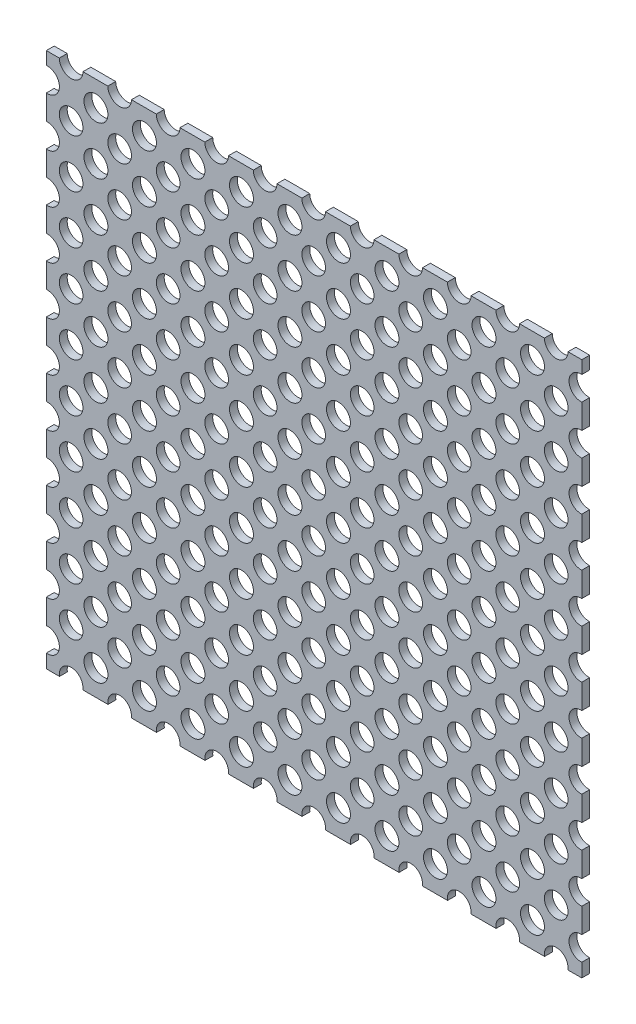
from build123d import *

# Parameters (mm, degrees)
SKETCH1_W                     = 215.9
SKETCH1_H                     = 215.9
BOSS_EXTRUDE1_DEPTH           = 3.175
SKETCH2_R                     = 4.7625
SKETCH2_R_2                   = 4.826
CUT_EXTRUDE1_DEPTH            = 3.175
LPATTERN1_COUNT               = 16
LPATTERN1_PITCH               = 19.558
LPATTERN1_COL_COUNT           = 2
LPATTERN1_COL_PITCH           = 19.558
LPATTERN2_COPY_1_SKETCH_R     = 4.7625
LPATTERN2_COPY_1_SKETCH_R_2   = 4.826
LPATTERN2_COPY_1_DEPTH        = 3.175
LPATTERN2_COPY_2_SKETCH_R     = 4.7625
LPATTERN2_COPY_2_SKETCH_R_2   = 4.826
LPATTERN2_COPY_2_DEPTH        = 3.175
LPATTERN2_COPY_3_SKETCH_R     = 4.7625
LPATTERN2_COPY_3_SKETCH_R_2   = 4.826
LPATTERN2_COPY_3_DEPTH        = 3.175
LPATTERN2_COPY_4_SKETCH_R     = 4.7625
LPATTERN2_COPY_4_SKETCH_R_2   = 4.826
LPATTERN2_COPY_4_DEPTH        = 3.175
LPATTERN2_COPY_5_SKETCH_R     = 4.7625
LPATTERN2_COPY_5_SKETCH_R_2   = 4.826
LPATTERN2_COPY_5_DEPTH        = 3.175
LPATTERN2_COPY_6_SKETCH_R     = 4.7625
LPATTERN2_COPY_6_SKETCH_R_2   = 4.826
LPATTERN2_COPY_6_DEPTH        = 3.175
LPATTERN2_COPY_7_SKETCH_R     = 4.7625
LPATTERN2_COPY_7_SKETCH_R_2   = 4.826
LPATTERN2_COPY_7_DEPTH        = 3.175
LPATTERN2_COPY_8_SKETCH_R     = 4.7625
LPATTERN2_COPY_8_SKETCH_R_2   = 4.826
LPATTERN2_COPY_8_DEPTH        = 3.175
LPATTERN2_COPY_9_SKETCH_R     = 4.7625
LPATTERN2_COPY_9_SKETCH_R_2   = 4.826
LPATTERN2_COPY_9_DEPTH        = 3.175
LPATTERN2_COPY_10_SKETCH_R    = 4.7625
LPATTERN2_COPY_10_SKETCH_R_2  = 4.826
LPATTERN2_COPY_10_DEPTH       = 3.175
LPATTERN2_COPY_11_SKETCH_R    = 4.7625
LPATTERN2_COPY_11_SKETCH_R_2  = 4.826
LPATTERN2_COPY_11_DEPTH       = 3.175
LPATTERN2_COPY_12_SKETCH_R    = 4.7625
LPATTERN2_COPY_12_SKETCH_R_2  = 4.826
LPATTERN2_COPY_12_DEPTH       = 3.175
LPATTERN2_COPY_13_SKETCH_R    = 4.7625
LPATTERN2_COPY_13_SKETCH_R_2  = 4.826
LPATTERN2_COPY_13_DEPTH       = 3.175
LPATTERN2_COPY_14_SKETCH_R    = 4.7625
LPATTERN2_COPY_14_SKETCH_R_2  = 4.826
LPATTERN2_COPY_14_DEPTH       = 3.175
LPATTERN2_COPY_15_SKETCH_R    = 4.7625
LPATTERN2_COPY_15_SKETCH_R_2  = 4.826
LPATTERN2_COPY_15_DEPTH       = 3.175
LPATTERN2_COPY_16_SKETCH_R    = 4.7625
LPATTERN2_COPY_16_SKETCH_R_2  = 4.826
LPATTERN2_COPY_16_DEPTH       = 3.175
LPATTERN2_COPY_17_SKETCH_R    = 4.7625
LPATTERN2_COPY_17_SKETCH_R_2  = 4.826
LPATTERN2_COPY_17_DEPTH       = 3.175
LPATTERN2_COPY_18_SKETCH_R    = 4.7625
LPATTERN2_COPY_18_SKETCH_R_2  = 4.826
LPATTERN2_COPY_18_DEPTH       = 3.175
LPATTERN2_COPY_19_SKETCH_R    = 4.7625
LPATTERN2_COPY_19_SKETCH_R_2  = 4.826
LPATTERN2_COPY_19_DEPTH       = 3.175
LPATTERN2_COPY_20_SKETCH_R    = 4.7625
LPATTERN2_COPY_20_SKETCH_R_2  = 4.826
LPATTERN2_COPY_20_DEPTH       = 3.175
LPATTERN2_COPY_21_SKETCH_R    = 4.7625
LPATTERN2_COPY_21_SKETCH_R_2  = 4.826
LPATTERN2_COPY_21_DEPTH       = 3.175
LPATTERN2_COPY_22_SKETCH_R    = 4.7625
LPATTERN2_COPY_22_SKETCH_R_2  = 4.826
LPATTERN2_COPY_22_DEPTH       = 3.175
LPATTERN2_COPY_23_SKETCH_R    = 4.7625
LPATTERN2_COPY_23_SKETCH_R_2  = 4.826
LPATTERN2_COPY_23_DEPTH       = 3.175
LPATTERN2_COPY_24_SKETCH_R    = 4.7625
LPATTERN2_COPY_24_SKETCH_R_2  = 4.826
LPATTERN2_COPY_24_DEPTH       = 3.175
LPATTERN2_COPY_25_SKETCH_R    = 4.7625
LPATTERN2_COPY_25_SKETCH_R_2  = 4.826
LPATTERN2_COPY_25_DEPTH       = 3.175
LPATTERN2_COPY_26_SKETCH_R    = 4.7625
LPATTERN2_COPY_26_SKETCH_R_2  = 4.826
LPATTERN2_COPY_26_DEPTH       = 3.175
LPATTERN2_COPY_27_SKETCH_R    = 4.7625
LPATTERN2_COPY_27_SKETCH_R_2  = 4.826
LPATTERN2_COPY_27_DEPTH       = 3.175
LPATTERN2_COPY_28_SKETCH_R    = 4.7625
LPATTERN2_COPY_28_SKETCH_R_2  = 4.826
LPATTERN2_COPY_28_DEPTH       = 3.175
LPATTERN2_COPY_29_SKETCH_R    = 4.7625
LPATTERN2_COPY_29_SKETCH_R_2  = 4.826
LPATTERN2_COPY_29_DEPTH       = 3.175
LPATTERN2_COPY_30_SKETCH_R    = 4.7625
LPATTERN2_COPY_30_SKETCH_R_2  = 4.826
LPATTERN2_COPY_30_DEPTH       = 3.175
LPATTERN2_COPY_31_SKETCH_R    = 4.7625
LPATTERN2_COPY_31_SKETCH_R_2  = 4.826
LPATTERN2_COPY_31_DEPTH       = 3.175
LPATTERN2_COPY_32_SKETCH_R    = 4.7625
LPATTERN2_COPY_32_SKETCH_R_2  = 4.826
LPATTERN2_COPY_32_DEPTH       = 3.175
LPATTERN2_COPY_33_SKETCH_R    = 4.7625
LPATTERN2_COPY_33_SKETCH_R_2  = 4.826
LPATTERN2_COPY_33_DEPTH       = 3.175
LPATTERN2_COPY_34_SKETCH_R    = 4.7625
LPATTERN2_COPY_34_SKETCH_R_2  = 4.826
LPATTERN2_COPY_34_DEPTH       = 3.175
LPATTERN2_COPY_35_SKETCH_R    = 4.7625
LPATTERN2_COPY_35_SKETCH_R_2  = 4.826
LPATTERN2_COPY_35_DEPTH       = 3.175
LPATTERN2_COPY_36_SKETCH_R    = 4.7625
LPATTERN2_COPY_36_SKETCH_R_2  = 4.826
LPATTERN2_COPY_36_DEPTH       = 3.175
LPATTERN2_COPY_37_SKETCH_R    = 4.7625
LPATTERN2_COPY_37_SKETCH_R_2  = 4.826
LPATTERN2_COPY_37_DEPTH       = 3.175
LPATTERN2_COPY_38_SKETCH_R    = 4.7625
LPATTERN2_COPY_38_SKETCH_R_2  = 4.826
LPATTERN2_COPY_38_DEPTH       = 3.175
LPATTERN2_COPY_39_SKETCH_R    = 4.7625
LPATTERN2_COPY_39_SKETCH_R_2  = 4.826
LPATTERN2_COPY_39_DEPTH       = 3.175
LPATTERN2_COPY_40_SKETCH_R    = 4.7625
LPATTERN2_COPY_40_SKETCH_R_2  = 4.826
LPATTERN2_COPY_40_DEPTH       = 3.175
LPATTERN2_COPY_41_SKETCH_R    = 4.7625
LPATTERN2_COPY_41_SKETCH_R_2  = 4.826
LPATTERN2_COPY_41_DEPTH       = 3.175
LPATTERN2_COPY_42_SKETCH_R    = 4.7625
LPATTERN2_COPY_42_SKETCH_R_2  = 4.826
LPATTERN2_COPY_42_DEPTH       = 3.175
LPATTERN2_COPY_43_SKETCH_R    = 4.7625
LPATTERN2_COPY_43_SKETCH_R_2  = 4.826
LPATTERN2_COPY_43_DEPTH       = 3.175
LPATTERN2_COPY_44_SKETCH_R    = 4.7625
LPATTERN2_COPY_44_SKETCH_R_2  = 4.826
LPATTERN2_COPY_44_DEPTH       = 3.175
LPATTERN2_COPY_45_SKETCH_R    = 4.7625
LPATTERN2_COPY_45_SKETCH_R_2  = 4.826
LPATTERN2_COPY_45_DEPTH       = 3.175
LPATTERN2_COPY_46_SKETCH_R    = 4.7625
LPATTERN2_COPY_46_SKETCH_R_2  = 4.826
LPATTERN2_COPY_46_DEPTH       = 3.175
LPATTERN2_COPY_47_SKETCH_R    = 4.7625
LPATTERN2_COPY_47_SKETCH_R_2  = 4.826
LPATTERN2_COPY_47_DEPTH       = 3.175
LPATTERN2_COPY_48_SKETCH_R    = 4.7625
LPATTERN2_COPY_48_SKETCH_R_2  = 4.826
LPATTERN2_COPY_48_DEPTH       = 3.175
LPATTERN2_COPY_49_SKETCH_R    = 4.7625
LPATTERN2_COPY_49_SKETCH_R_2  = 4.826
LPATTERN2_COPY_49_DEPTH       = 3.175
LPATTERN2_COPY_50_SKETCH_R    = 4.7625
LPATTERN2_COPY_50_SKETCH_R_2  = 4.826
LPATTERN2_COPY_50_DEPTH       = 3.175
LPATTERN2_COPY_51_SKETCH_R    = 4.7625
LPATTERN2_COPY_51_SKETCH_R_2  = 4.826
LPATTERN2_COPY_51_DEPTH       = 3.175
LPATTERN2_COPY_52_SKETCH_R    = 4.7625
LPATTERN2_COPY_52_SKETCH_R_2  = 4.826
LPATTERN2_COPY_52_DEPTH       = 3.175
LPATTERN2_COPY_53_SKETCH_R    = 4.7625
LPATTERN2_COPY_53_SKETCH_R_2  = 4.826
LPATTERN2_COPY_53_DEPTH       = 3.175
LPATTERN2_COPY_54_SKETCH_R    = 4.7625
LPATTERN2_COPY_54_SKETCH_R_2  = 4.826
LPATTERN2_COPY_54_DEPTH       = 3.175
LPATTERN2_COPY_55_SKETCH_R    = 4.7625
LPATTERN2_COPY_55_SKETCH_R_2  = 4.826
LPATTERN2_COPY_55_DEPTH       = 3.175
LPATTERN2_COPY_56_SKETCH_R    = 4.7625
LPATTERN2_COPY_56_SKETCH_R_2  = 4.826
LPATTERN2_COPY_56_DEPTH       = 3.175
LPATTERN2_COPY_57_SKETCH_R    = 4.7625
LPATTERN2_COPY_57_SKETCH_R_2  = 4.826
LPATTERN2_COPY_57_DEPTH       = 3.175
LPATTERN2_COPY_58_SKETCH_R    = 4.7625
LPATTERN2_COPY_58_SKETCH_R_2  = 4.826
LPATTERN2_COPY_58_DEPTH       = 3.175
LPATTERN2_COPY_59_SKETCH_R    = 4.7625
LPATTERN2_COPY_59_SKETCH_R_2  = 4.826
LPATTERN2_COPY_59_DEPTH       = 3.175
LPATTERN2_COPY_60_SKETCH_R    = 4.7625
LPATTERN2_COPY_60_SKETCH_R_2  = 4.826
LPATTERN2_COPY_60_DEPTH       = 3.175
LPATTERN2_COPY_61_SKETCH_R    = 4.7625
LPATTERN2_COPY_61_SKETCH_R_2  = 4.826
LPATTERN2_COPY_61_DEPTH       = 3.175
LPATTERN2_COPY_62_SKETCH_R    = 4.7625
LPATTERN2_COPY_62_SKETCH_R_2  = 4.826
LPATTERN2_COPY_62_DEPTH       = 3.175
LPATTERN2_COPY_63_SKETCH_R    = 4.7625
LPATTERN2_COPY_63_SKETCH_R_2  = 4.826
LPATTERN2_COPY_63_DEPTH       = 3.175
LPATTERN2_COPY_64_SKETCH_R    = 4.7625
LPATTERN2_COPY_64_SKETCH_R_2  = 4.826
LPATTERN2_COPY_64_DEPTH       = 3.175
LPATTERN2_COPY_65_SKETCH_R    = 4.7625
LPATTERN2_COPY_65_SKETCH_R_2  = 4.826
LPATTERN2_COPY_65_DEPTH       = 3.175
LPATTERN2_COPY_66_SKETCH_R    = 4.7625
LPATTERN2_COPY_66_SKETCH_R_2  = 4.826
LPATTERN2_COPY_66_DEPTH       = 3.175
LPATTERN2_COPY_67_SKETCH_R    = 4.7625
LPATTERN2_COPY_67_SKETCH_R_2  = 4.826
LPATTERN2_COPY_67_DEPTH       = 3.175
LPATTERN2_COPY_68_SKETCH_R    = 4.7625
LPATTERN2_COPY_68_SKETCH_R_2  = 4.826
LPATTERN2_COPY_68_DEPTH       = 3.175
LPATTERN2_COPY_69_SKETCH_R    = 4.7625
LPATTERN2_COPY_69_SKETCH_R_2  = 4.826
LPATTERN2_COPY_69_DEPTH       = 3.175
LPATTERN2_COPY_70_SKETCH_R    = 4.7625
LPATTERN2_COPY_70_SKETCH_R_2  = 4.826
LPATTERN2_COPY_70_DEPTH       = 3.175
LPATTERN2_COPY_71_SKETCH_R    = 4.7625
LPATTERN2_COPY_71_SKETCH_R_2  = 4.826
LPATTERN2_COPY_71_DEPTH       = 3.175
LPATTERN2_COPY_72_SKETCH_R    = 4.7625
LPATTERN2_COPY_72_SKETCH_R_2  = 4.826
LPATTERN2_COPY_72_DEPTH       = 3.175
LPATTERN2_COPY_73_SKETCH_R    = 4.7625
LPATTERN2_COPY_73_SKETCH_R_2  = 4.826
LPATTERN2_COPY_73_DEPTH       = 3.175
LPATTERN2_COPY_74_SKETCH_R    = 4.7625
LPATTERN2_COPY_74_SKETCH_R_2  = 4.826
LPATTERN2_COPY_74_DEPTH       = 3.175
LPATTERN2_COPY_75_SKETCH_R    = 4.7625
LPATTERN2_COPY_75_SKETCH_R_2  = 4.826
LPATTERN2_COPY_75_DEPTH       = 3.175
LPATTERN2_COPY_76_SKETCH_R    = 4.7625
LPATTERN2_COPY_76_SKETCH_R_2  = 4.826
LPATTERN2_COPY_76_DEPTH       = 3.175
LPATTERN2_COPY_77_SKETCH_R    = 4.7625
LPATTERN2_COPY_77_SKETCH_R_2  = 4.826
LPATTERN2_COPY_77_DEPTH       = 3.175
LPATTERN2_COPY_78_SKETCH_R    = 4.7625
LPATTERN2_COPY_78_SKETCH_R_2  = 4.826
LPATTERN2_COPY_78_DEPTH       = 3.175
LPATTERN2_COPY_79_SKETCH_R    = 4.7625
LPATTERN2_COPY_79_SKETCH_R_2  = 4.826
LPATTERN2_COPY_79_DEPTH       = 3.175
LPATTERN2_COPY_80_SKETCH_R    = 4.7625
LPATTERN2_COPY_80_SKETCH_R_2  = 4.826
LPATTERN2_COPY_80_DEPTH       = 3.175
LPATTERN2_COPY_81_SKETCH_R    = 4.7625
LPATTERN2_COPY_81_SKETCH_R_2  = 4.826
LPATTERN2_COPY_81_DEPTH       = 3.175
LPATTERN2_COPY_82_SKETCH_R    = 4.7625
LPATTERN2_COPY_82_SKETCH_R_2  = 4.826
LPATTERN2_COPY_82_DEPTH       = 3.175
LPATTERN2_COPY_83_SKETCH_R    = 4.7625
LPATTERN2_COPY_83_SKETCH_R_2  = 4.826
LPATTERN2_COPY_83_DEPTH       = 3.175
LPATTERN2_COPY_84_SKETCH_R    = 4.7625
LPATTERN2_COPY_84_SKETCH_R_2  = 4.826
LPATTERN2_COPY_84_DEPTH       = 3.175
LPATTERN2_COPY_85_SKETCH_R    = 4.7625
LPATTERN2_COPY_85_SKETCH_R_2  = 4.826
LPATTERN2_COPY_85_DEPTH       = 3.175
LPATTERN2_COPY_86_SKETCH_R    = 4.7625
LPATTERN2_COPY_86_SKETCH_R_2  = 4.826
LPATTERN2_COPY_86_DEPTH       = 3.175
LPATTERN2_COPY_87_SKETCH_R    = 4.7625
LPATTERN2_COPY_87_SKETCH_R_2  = 4.826
LPATTERN2_COPY_87_DEPTH       = 3.175
LPATTERN2_COPY_88_SKETCH_R    = 4.7625
LPATTERN2_COPY_88_SKETCH_R_2  = 4.826
LPATTERN2_COPY_88_DEPTH       = 3.175
LPATTERN2_COPY_89_SKETCH_R    = 4.7625
LPATTERN2_COPY_89_SKETCH_R_2  = 4.826
LPATTERN2_COPY_89_DEPTH       = 3.175
LPATTERN2_COPY_90_SKETCH_R    = 4.7625
LPATTERN2_COPY_90_SKETCH_R_2  = 4.826
LPATTERN2_COPY_90_DEPTH       = 3.175
LPATTERN2_COPY_91_SKETCH_R    = 4.7625
LPATTERN2_COPY_91_SKETCH_R_2  = 4.826
LPATTERN2_COPY_91_DEPTH       = 3.175
LPATTERN2_COPY_92_SKETCH_R    = 4.7625
LPATTERN2_COPY_92_SKETCH_R_2  = 4.826
LPATTERN2_COPY_92_DEPTH       = 3.175
LPATTERN2_COPY_93_SKETCH_R    = 4.7625
LPATTERN2_COPY_93_SKETCH_R_2  = 4.826
LPATTERN2_COPY_93_DEPTH       = 3.175
LPATTERN2_COPY_94_SKETCH_R    = 4.7625
LPATTERN2_COPY_94_SKETCH_R_2  = 4.826
LPATTERN2_COPY_94_DEPTH       = 3.175
LPATTERN2_COPY_95_SKETCH_R    = 4.7625
LPATTERN2_COPY_95_SKETCH_R_2  = 4.826
LPATTERN2_COPY_95_DEPTH       = 3.175
LPATTERN2_COPY_96_SKETCH_R    = 4.7625
LPATTERN2_COPY_96_SKETCH_R_2  = 4.826
LPATTERN2_COPY_96_DEPTH       = 3.175
LPATTERN2_COPY_97_SKETCH_R    = 4.7625
LPATTERN2_COPY_97_SKETCH_R_2  = 4.826
LPATTERN2_COPY_97_DEPTH       = 3.175
LPATTERN2_COPY_98_SKETCH_R    = 4.7625
LPATTERN2_COPY_98_SKETCH_R_2  = 4.826
LPATTERN2_COPY_98_DEPTH       = 3.175
LPATTERN2_COPY_99_SKETCH_R    = 4.7625
LPATTERN2_COPY_99_SKETCH_R_2  = 4.826
LPATTERN2_COPY_99_DEPTH       = 3.175
LPATTERN2_COPY_100_SKETCH_R   = 4.7625
LPATTERN2_COPY_100_SKETCH_R_2 = 4.826
LPATTERN2_COPY_100_DEPTH      = 3.175
LPATTERN2_COPY_101_SKETCH_R   = 4.7625
LPATTERN2_COPY_101_SKETCH_R_2 = 4.826
LPATTERN2_COPY_101_DEPTH      = 3.175
LPATTERN2_COPY_102_SKETCH_R   = 4.7625
LPATTERN2_COPY_102_SKETCH_R_2 = 4.826
LPATTERN2_COPY_102_DEPTH      = 3.175
LPATTERN2_COPY_103_SKETCH_R   = 4.7625
LPATTERN2_COPY_103_SKETCH_R_2 = 4.826
LPATTERN2_COPY_103_DEPTH      = 3.175
LPATTERN2_COPY_104_SKETCH_R   = 4.7625
LPATTERN2_COPY_104_SKETCH_R_2 = 4.826
LPATTERN2_COPY_104_DEPTH      = 3.175
LPATTERN2_COPY_105_SKETCH_R   = 4.7625
LPATTERN2_COPY_105_SKETCH_R_2 = 4.826
LPATTERN2_COPY_105_DEPTH      = 3.175
LPATTERN2_COPY_106_SKETCH_R   = 4.7625
LPATTERN2_COPY_106_SKETCH_R_2 = 4.826
LPATTERN2_COPY_106_DEPTH      = 3.175
LPATTERN2_COPY_107_SKETCH_R   = 4.7625
LPATTERN2_COPY_107_SKETCH_R_2 = 4.826
LPATTERN2_COPY_107_DEPTH      = 3.175
LPATTERN2_COPY_108_SKETCH_R   = 4.7625
LPATTERN2_COPY_108_SKETCH_R_2 = 4.826
LPATTERN2_COPY_108_DEPTH      = 3.175
LPATTERN2_COPY_109_SKETCH_R   = 4.7625
LPATTERN2_COPY_109_SKETCH_R_2 = 4.826
LPATTERN2_COPY_109_DEPTH      = 3.175
LPATTERN2_COPY_110_SKETCH_R   = 4.7625
LPATTERN2_COPY_110_SKETCH_R_2 = 4.826
LPATTERN2_COPY_110_DEPTH      = 3.175
LPATTERN2_COPY_111_SKETCH_R   = 4.7625
LPATTERN2_COPY_111_SKETCH_R_2 = 4.826
LPATTERN2_COPY_111_DEPTH      = 3.175
LPATTERN2_COPY_112_SKETCH_R   = 4.7625
LPATTERN2_COPY_112_SKETCH_R_2 = 4.826
LPATTERN2_COPY_112_DEPTH      = 3.175
LPATTERN2_COPY_113_SKETCH_R   = 4.7625
LPATTERN2_COPY_113_SKETCH_R_2 = 4.826
LPATTERN2_COPY_113_DEPTH      = 3.175
LPATTERN2_COPY_114_SKETCH_R   = 4.7625
LPATTERN2_COPY_114_SKETCH_R_2 = 4.826
LPATTERN2_COPY_114_DEPTH      = 3.175
LPATTERN2_COPY_115_SKETCH_R   = 4.7625
LPATTERN2_COPY_115_SKETCH_R_2 = 4.826
LPATTERN2_COPY_115_DEPTH      = 3.175
LPATTERN2_COPY_116_SKETCH_R   = 4.7625
LPATTERN2_COPY_116_SKETCH_R_2 = 4.826
LPATTERN2_COPY_116_DEPTH      = 3.175
LPATTERN2_COPY_117_SKETCH_R   = 4.7625
LPATTERN2_COPY_117_SKETCH_R_2 = 4.826
LPATTERN2_COPY_117_DEPTH      = 3.175
LPATTERN2_COPY_118_SKETCH_R   = 4.7625
LPATTERN2_COPY_118_SKETCH_R_2 = 4.826
LPATTERN2_COPY_118_DEPTH      = 3.175
LPATTERN2_COPY_119_SKETCH_R   = 4.7625
LPATTERN2_COPY_119_SKETCH_R_2 = 4.826
LPATTERN2_COPY_119_DEPTH      = 3.175
LPATTERN2_COPY_120_SKETCH_R   = 4.7625
LPATTERN2_COPY_120_SKETCH_R_2 = 4.826
LPATTERN2_COPY_120_DEPTH      = 3.175
LPATTERN2_COPY_121_SKETCH_R   = 4.7625
LPATTERN2_COPY_121_SKETCH_R_2 = 4.826
LPATTERN2_COPY_121_DEPTH      = 3.175
LPATTERN2_COPY_122_SKETCH_R   = 4.7625
LPATTERN2_COPY_122_SKETCH_R_2 = 4.826
LPATTERN2_COPY_122_DEPTH      = 3.175
LPATTERN2_COPY_123_SKETCH_R   = 4.7625
LPATTERN2_COPY_123_SKETCH_R_2 = 4.826
LPATTERN2_COPY_123_DEPTH      = 3.175
LPATTERN2_COPY_124_SKETCH_R   = 4.7625
LPATTERN2_COPY_124_SKETCH_R_2 = 4.826
LPATTERN2_COPY_124_DEPTH      = 3.175
LPATTERN2_COPY_125_SKETCH_R   = 4.7625
LPATTERN2_COPY_125_SKETCH_R_2 = 4.826
LPATTERN2_COPY_125_DEPTH      = 3.175
LPATTERN2_COPY_126_SKETCH_R   = 4.7625
LPATTERN2_COPY_126_SKETCH_R_2 = 4.826
LPATTERN2_COPY_126_DEPTH      = 3.175
LPATTERN2_COPY_127_SKETCH_R   = 4.7625
LPATTERN2_COPY_127_SKETCH_R_2 = 4.826
LPATTERN2_COPY_127_DEPTH      = 3.175
LPATTERN2_COPY_128_SKETCH_R   = 4.7625
LPATTERN2_COPY_128_SKETCH_R_2 = 4.826
LPATTERN2_COPY_128_DEPTH      = 3.175
LPATTERN2_COPY_129_SKETCH_R   = 4.7625
LPATTERN2_COPY_129_SKETCH_R_2 = 4.826
LPATTERN2_COPY_129_DEPTH      = 3.175
LPATTERN2_COPY_130_SKETCH_R   = 4.7625
LPATTERN2_COPY_130_SKETCH_R_2 = 4.826
LPATTERN2_COPY_130_DEPTH      = 3.175
LPATTERN2_COPY_131_SKETCH_R   = 4.7625
LPATTERN2_COPY_131_SKETCH_R_2 = 4.826
LPATTERN2_COPY_131_DEPTH      = 3.175
LPATTERN2_COPY_132_SKETCH_R   = 4.7625
LPATTERN2_COPY_132_SKETCH_R_2 = 4.826
LPATTERN2_COPY_132_DEPTH      = 3.175
LPATTERN2_COPY_133_SKETCH_R   = 4.7625
LPATTERN2_COPY_133_SKETCH_R_2 = 4.826
LPATTERN2_COPY_133_DEPTH      = 3.175
LPATTERN2_COPY_134_SKETCH_R   = 4.7625
LPATTERN2_COPY_134_SKETCH_R_2 = 4.826
LPATTERN2_COPY_134_DEPTH      = 3.175
LPATTERN2_COPY_135_SKETCH_R   = 4.7625
LPATTERN2_COPY_135_SKETCH_R_2 = 4.826
LPATTERN2_COPY_135_DEPTH      = 3.175
LPATTERN2_COPY_136_SKETCH_R   = 4.7625
LPATTERN2_COPY_136_SKETCH_R_2 = 4.826
LPATTERN2_COPY_136_DEPTH      = 3.175
LPATTERN2_COPY_137_SKETCH_R   = 4.7625
LPATTERN2_COPY_137_SKETCH_R_2 = 4.826
LPATTERN2_COPY_137_DEPTH      = 3.175
LPATTERN2_COPY_138_SKETCH_R   = 4.7625
LPATTERN2_COPY_138_SKETCH_R_2 = 4.826
LPATTERN2_COPY_138_DEPTH      = 3.175
LPATTERN2_COPY_139_SKETCH_R   = 4.7625
LPATTERN2_COPY_139_SKETCH_R_2 = 4.826
LPATTERN2_COPY_139_DEPTH      = 3.175
LPATTERN2_COPY_140_SKETCH_R   = 4.7625
LPATTERN2_COPY_140_SKETCH_R_2 = 4.826
LPATTERN2_COPY_140_DEPTH      = 3.175
LPATTERN2_COPY_141_SKETCH_R   = 4.7625
LPATTERN2_COPY_141_SKETCH_R_2 = 4.826
LPATTERN2_COPY_141_DEPTH      = 3.175
LPATTERN2_COPY_142_SKETCH_R   = 4.7625
LPATTERN2_COPY_142_SKETCH_R_2 = 4.826
LPATTERN2_COPY_142_DEPTH      = 3.175
LPATTERN2_COPY_143_SKETCH_R   = 4.7625
LPATTERN2_COPY_143_SKETCH_R_2 = 4.826
LPATTERN2_COPY_143_DEPTH      = 3.175
LPATTERN2_COPY_144_SKETCH_R   = 4.7625
LPATTERN2_COPY_144_SKETCH_R_2 = 4.826
LPATTERN2_COPY_144_DEPTH      = 3.175
LPATTERN2_COPY_145_SKETCH_R   = 4.7625
LPATTERN2_COPY_145_SKETCH_R_2 = 4.826
LPATTERN2_COPY_145_DEPTH      = 3.175
LPATTERN2_COPY_146_SKETCH_R   = 4.7625
LPATTERN2_COPY_146_SKETCH_R_2 = 4.826
LPATTERN2_COPY_146_DEPTH      = 3.175
LPATTERN2_COPY_147_SKETCH_R   = 4.7625
LPATTERN2_COPY_147_SKETCH_R_2 = 4.826
LPATTERN2_COPY_147_DEPTH      = 3.175
LPATTERN2_COPY_148_SKETCH_R   = 4.7625
LPATTERN2_COPY_148_SKETCH_R_2 = 4.826
LPATTERN2_COPY_148_DEPTH      = 3.175
LPATTERN2_COPY_149_SKETCH_R   = 4.7625
LPATTERN2_COPY_149_SKETCH_R_2 = 4.826
LPATTERN2_COPY_149_DEPTH      = 3.175
LPATTERN2_COPY_150_SKETCH_R   = 4.7625
LPATTERN2_COPY_150_SKETCH_R_2 = 4.826
LPATTERN2_COPY_150_DEPTH      = 3.175
LPATTERN2_COPY_151_SKETCH_R   = 4.7625
LPATTERN2_COPY_151_SKETCH_R_2 = 4.826
LPATTERN2_COPY_151_DEPTH      = 3.175
LPATTERN2_COPY_152_SKETCH_R   = 4.7625
LPATTERN2_COPY_152_SKETCH_R_2 = 4.826
LPATTERN2_COPY_152_DEPTH      = 3.175
LPATTERN2_COPY_153_SKETCH_R   = 4.7625
LPATTERN2_COPY_153_SKETCH_R_2 = 4.826
LPATTERN2_COPY_153_DEPTH      = 3.175
LPATTERN2_COPY_154_SKETCH_R   = 4.7625
LPATTERN2_COPY_154_SKETCH_R_2 = 4.826
LPATTERN2_COPY_154_DEPTH      = 3.175
LPATTERN2_COPY_155_SKETCH_R   = 4.7625
LPATTERN2_COPY_155_SKETCH_R_2 = 4.826
LPATTERN2_COPY_155_DEPTH      = 3.175
LPATTERN2_COPY_156_SKETCH_R   = 4.7625
LPATTERN2_COPY_156_SKETCH_R_2 = 4.826
LPATTERN2_COPY_156_DEPTH      = 3.175
LPATTERN2_COPY_157_SKETCH_R   = 4.7625
LPATTERN2_COPY_157_SKETCH_R_2 = 4.826
LPATTERN2_COPY_157_DEPTH      = 3.175
LPATTERN2_COPY_158_SKETCH_R   = 4.7625
LPATTERN2_COPY_158_SKETCH_R_2 = 4.826
LPATTERN2_COPY_158_DEPTH      = 3.175
LPATTERN2_COPY_159_SKETCH_R   = 4.7625
LPATTERN2_COPY_159_SKETCH_R_2 = 4.826
LPATTERN2_COPY_159_DEPTH      = 3.175
LPATTERN2_COPY_160_SKETCH_R   = 4.7625
LPATTERN2_COPY_160_SKETCH_R_2 = 4.826
LPATTERN2_COPY_160_DEPTH      = 3.175
LPATTERN2_COPY_161_SKETCH_R   = 4.7625
LPATTERN2_COPY_161_SKETCH_R_2 = 4.826
LPATTERN2_COPY_161_DEPTH      = 3.175
LPATTERN2_COPY_162_SKETCH_R   = 4.7625
LPATTERN2_COPY_162_SKETCH_R_2 = 4.826
LPATTERN2_COPY_162_DEPTH      = 3.175
LPATTERN2_COPY_163_SKETCH_R   = 4.7625
LPATTERN2_COPY_163_SKETCH_R_2 = 4.826
LPATTERN2_COPY_163_DEPTH      = 3.175
LPATTERN2_COPY_164_SKETCH_R   = 4.7625
LPATTERN2_COPY_164_SKETCH_R_2 = 4.826
LPATTERN2_COPY_164_DEPTH      = 3.175
LPATTERN2_COPY_165_SKETCH_R   = 4.7625
LPATTERN2_COPY_165_SKETCH_R_2 = 4.826
LPATTERN2_COPY_165_DEPTH      = 3.175
LPATTERN2_COPY_166_SKETCH_R   = 4.7625
LPATTERN2_COPY_166_SKETCH_R_2 = 4.826
LPATTERN2_COPY_166_DEPTH      = 3.175
LPATTERN2_COPY_167_SKETCH_R   = 4.7625
LPATTERN2_COPY_167_SKETCH_R_2 = 4.826
LPATTERN2_COPY_167_DEPTH      = 3.175
LPATTERN2_COPY_168_SKETCH_R   = 4.7625
LPATTERN2_COPY_168_SKETCH_R_2 = 4.826
LPATTERN2_COPY_168_DEPTH      = 3.175
LPATTERN2_COPY_169_SKETCH_R   = 4.7625
LPATTERN2_COPY_169_SKETCH_R_2 = 4.826
LPATTERN2_COPY_169_DEPTH      = 3.175
LPATTERN2_COPY_170_SKETCH_R   = 4.7625
LPATTERN2_COPY_170_SKETCH_R_2 = 4.826
LPATTERN2_COPY_170_DEPTH      = 3.175
LPATTERN2_COPY_171_SKETCH_R   = 4.7625
LPATTERN2_COPY_171_SKETCH_R_2 = 4.826
LPATTERN2_COPY_171_DEPTH      = 3.175
LPATTERN2_COPY_172_SKETCH_R   = 4.7625
LPATTERN2_COPY_172_SKETCH_R_2 = 4.826
LPATTERN2_COPY_172_DEPTH      = 3.175
LPATTERN2_COPY_173_SKETCH_R   = 4.7625
LPATTERN2_COPY_173_SKETCH_R_2 = 4.826
LPATTERN2_COPY_173_DEPTH      = 3.175
LPATTERN2_COPY_174_SKETCH_R   = 4.7625
LPATTERN2_COPY_174_SKETCH_R_2 = 4.826
LPATTERN2_COPY_174_DEPTH      = 3.175
LPATTERN2_COPY_175_SKETCH_R   = 4.7625
LPATTERN2_COPY_175_SKETCH_R_2 = 4.826
LPATTERN2_COPY_175_DEPTH      = 3.175
LPATTERN2_COPY_176_SKETCH_R   = 4.7625
LPATTERN2_COPY_176_SKETCH_R_2 = 4.826
LPATTERN2_COPY_176_DEPTH      = 3.175
LPATTERN2_COPY_177_SKETCH_R   = 4.7625
LPATTERN2_COPY_177_SKETCH_R_2 = 4.826
LPATTERN2_COPY_177_DEPTH      = 3.175
LPATTERN2_COPY_178_SKETCH_R   = 4.7625
LPATTERN2_COPY_178_SKETCH_R_2 = 4.826
LPATTERN2_COPY_178_DEPTH      = 3.175
LPATTERN2_COPY_179_SKETCH_R   = 4.7625
LPATTERN2_COPY_179_SKETCH_R_2 = 4.826
LPATTERN2_COPY_179_DEPTH      = 3.175
LPATTERN2_COPY_180_SKETCH_R   = 4.7625
LPATTERN2_COPY_180_SKETCH_R_2 = 4.826
LPATTERN2_COPY_180_DEPTH      = 3.175
LPATTERN2_COPY_181_SKETCH_R   = 4.7625
LPATTERN2_COPY_181_SKETCH_R_2 = 4.826
LPATTERN2_COPY_181_DEPTH      = 3.175
LPATTERN2_COPY_182_SKETCH_R   = 4.7625
LPATTERN2_COPY_182_SKETCH_R_2 = 4.826
LPATTERN2_COPY_182_DEPTH      = 3.175
LPATTERN2_COPY_183_SKETCH_R   = 4.7625
LPATTERN2_COPY_183_SKETCH_R_2 = 4.826
LPATTERN2_COPY_183_DEPTH      = 3.175
LPATTERN2_COPY_184_SKETCH_R   = 4.7625
LPATTERN2_COPY_184_SKETCH_R_2 = 4.826
LPATTERN2_COPY_184_DEPTH      = 3.175
LPATTERN2_COPY_185_SKETCH_R   = 4.7625
LPATTERN2_COPY_185_SKETCH_R_2 = 4.826
LPATTERN2_COPY_185_DEPTH      = 3.175
LPATTERN2_COPY_186_SKETCH_R   = 4.7625
LPATTERN2_COPY_186_SKETCH_R_2 = 4.826
LPATTERN2_COPY_186_DEPTH      = 3.175
LPATTERN2_COPY_187_SKETCH_R   = 4.7625
LPATTERN2_COPY_187_SKETCH_R_2 = 4.826
LPATTERN2_COPY_187_DEPTH      = 3.175
LPATTERN2_COPY_188_SKETCH_R   = 4.7625
LPATTERN2_COPY_188_SKETCH_R_2 = 4.826
LPATTERN2_COPY_188_DEPTH      = 3.175
LPATTERN2_COPY_189_SKETCH_R   = 4.7625
LPATTERN2_COPY_189_SKETCH_R_2 = 4.826
LPATTERN2_COPY_189_DEPTH      = 3.175
LPATTERN2_COPY_190_SKETCH_R   = 4.7625
LPATTERN2_COPY_190_SKETCH_R_2 = 4.826
LPATTERN2_COPY_190_DEPTH      = 3.175
LPATTERN2_COPY_191_SKETCH_R   = 4.7625
LPATTERN2_COPY_191_SKETCH_R_2 = 4.826
LPATTERN2_COPY_191_DEPTH      = 3.175
LPATTERN2_COPY_192_SKETCH_R   = 4.7625
LPATTERN2_COPY_192_SKETCH_R_2 = 4.826
LPATTERN2_COPY_192_DEPTH      = 3.175
LPATTERN2_COPY_193_SKETCH_R   = 4.7625
LPATTERN2_COPY_193_SKETCH_R_2 = 4.826
LPATTERN2_COPY_193_DEPTH      = 3.175
LPATTERN2_COPY_194_SKETCH_R   = 4.7625
LPATTERN2_COPY_194_SKETCH_R_2 = 4.826
LPATTERN2_COPY_194_DEPTH      = 3.175
LPATTERN2_COPY_195_SKETCH_R   = 4.7625
LPATTERN2_COPY_195_SKETCH_R_2 = 4.826
LPATTERN2_COPY_195_DEPTH      = 3.175
LPATTERN2_COPY_196_SKETCH_R   = 4.7625
LPATTERN2_COPY_196_SKETCH_R_2 = 4.826
LPATTERN2_COPY_196_DEPTH      = 3.175
LPATTERN2_COPY_197_SKETCH_R   = 4.7625
LPATTERN2_COPY_197_SKETCH_R_2 = 4.826
LPATTERN2_COPY_197_DEPTH      = 3.175
LPATTERN2_COPY_198_SKETCH_R   = 4.7625
LPATTERN2_COPY_198_SKETCH_R_2 = 4.826
LPATTERN2_COPY_198_DEPTH      = 3.175
LPATTERN2_COPY_199_SKETCH_R   = 4.7625
LPATTERN2_COPY_199_SKETCH_R_2 = 4.826
LPATTERN2_COPY_199_DEPTH      = 3.175
LPATTERN2_COPY_200_SKETCH_R   = 4.7625
LPATTERN2_COPY_200_SKETCH_R_2 = 4.826
LPATTERN2_COPY_200_DEPTH      = 3.175
LPATTERN2_COPY_201_SKETCH_R   = 4.7625
LPATTERN2_COPY_201_SKETCH_R_2 = 4.826
LPATTERN2_COPY_201_DEPTH      = 3.175
LPATTERN2_COPY_202_SKETCH_R   = 4.7625
LPATTERN2_COPY_202_SKETCH_R_2 = 4.826
LPATTERN2_COPY_202_DEPTH      = 3.175
LPATTERN2_COPY_203_SKETCH_R   = 4.7625
LPATTERN2_COPY_203_SKETCH_R_2 = 4.826
LPATTERN2_COPY_203_DEPTH      = 3.175
LPATTERN2_COPY_204_SKETCH_R   = 4.7625
LPATTERN2_COPY_204_SKETCH_R_2 = 4.826
LPATTERN2_COPY_204_DEPTH      = 3.175
LPATTERN2_COPY_205_SKETCH_R   = 4.7625
LPATTERN2_COPY_205_SKETCH_R_2 = 4.826
LPATTERN2_COPY_205_DEPTH      = 3.175
LPATTERN2_COPY_206_SKETCH_R   = 4.7625
LPATTERN2_COPY_206_SKETCH_R_2 = 4.826
LPATTERN2_COPY_206_DEPTH      = 3.175
LPATTERN2_COPY_207_SKETCH_R   = 4.7625
LPATTERN2_COPY_207_SKETCH_R_2 = 4.826
LPATTERN2_COPY_207_DEPTH      = 3.175
LPATTERN2_COPY_208_SKETCH_R   = 4.7625
LPATTERN2_COPY_208_SKETCH_R_2 = 4.826
LPATTERN2_COPY_208_DEPTH      = 3.175
LPATTERN2_COPY_209_SKETCH_R   = 4.7625
LPATTERN2_COPY_209_SKETCH_R_2 = 4.826
LPATTERN2_COPY_209_DEPTH      = 3.175
LPATTERN2_COPY_210_SKETCH_R   = 4.7625
LPATTERN2_COPY_210_SKETCH_R_2 = 4.826
LPATTERN2_COPY_210_DEPTH      = 3.175
LPATTERN2_COPY_211_SKETCH_R   = 4.7625
LPATTERN2_COPY_211_SKETCH_R_2 = 4.826
LPATTERN2_COPY_211_DEPTH      = 3.175
LPATTERN2_COPY_212_SKETCH_R   = 4.7625
LPATTERN2_COPY_212_SKETCH_R_2 = 4.826
LPATTERN2_COPY_212_DEPTH      = 3.175
LPATTERN2_COPY_213_SKETCH_R   = 4.7625
LPATTERN2_COPY_213_SKETCH_R_2 = 4.826
LPATTERN2_COPY_213_DEPTH      = 3.175
LPATTERN2_COPY_214_SKETCH_R   = 4.7625
LPATTERN2_COPY_214_SKETCH_R_2 = 4.826
LPATTERN2_COPY_214_DEPTH      = 3.175
LPATTERN2_COPY_215_SKETCH_R   = 4.7625
LPATTERN2_COPY_215_SKETCH_R_2 = 4.826
LPATTERN2_COPY_215_DEPTH      = 3.175
LPATTERN2_COPY_216_SKETCH_R   = 4.7625
LPATTERN2_COPY_216_SKETCH_R_2 = 4.826
LPATTERN2_COPY_216_DEPTH      = 3.175
LPATTERN2_COPY_217_SKETCH_R   = 4.7625
LPATTERN2_COPY_217_SKETCH_R_2 = 4.826
LPATTERN2_COPY_217_DEPTH      = 3.175
LPATTERN2_COPY_218_SKETCH_R   = 4.7625
LPATTERN2_COPY_218_SKETCH_R_2 = 4.826
LPATTERN2_COPY_218_DEPTH      = 3.175
LPATTERN2_COPY_219_SKETCH_R   = 4.7625
LPATTERN2_COPY_219_SKETCH_R_2 = 4.826
LPATTERN2_COPY_219_DEPTH      = 3.175
LPATTERN2_COPY_220_SKETCH_R   = 4.7625
LPATTERN2_COPY_220_SKETCH_R_2 = 4.826
LPATTERN2_COPY_220_DEPTH      = 3.175
LPATTERN2_COPY_221_SKETCH_R   = 4.7625
LPATTERN2_COPY_221_SKETCH_R_2 = 4.826
LPATTERN2_COPY_221_DEPTH      = 3.175
LPATTERN2_COPY_222_SKETCH_R   = 4.7625
LPATTERN2_COPY_222_SKETCH_R_2 = 4.826
LPATTERN2_COPY_222_DEPTH      = 3.175
LPATTERN2_COPY_223_SKETCH_R   = 4.7625
LPATTERN2_COPY_223_SKETCH_R_2 = 4.826
LPATTERN2_COPY_223_DEPTH      = 3.175
LPATTERN2_COPY_224_SKETCH_R   = 4.7625
LPATTERN2_COPY_224_SKETCH_R_2 = 4.826
LPATTERN2_COPY_224_DEPTH      = 3.175
LPATTERN2_COPY_225_SKETCH_R   = 4.7625
LPATTERN2_COPY_225_SKETCH_R_2 = 4.826
LPATTERN2_COPY_225_DEPTH      = 3.175
LPATTERN2_COPY_226_SKETCH_R   = 4.7625
LPATTERN2_COPY_226_SKETCH_R_2 = 4.826
LPATTERN2_COPY_226_DEPTH      = 3.175
LPATTERN2_COPY_227_SKETCH_R   = 4.7625
LPATTERN2_COPY_227_SKETCH_R_2 = 4.826
LPATTERN2_COPY_227_DEPTH      = 3.175
LPATTERN2_COPY_228_SKETCH_R   = 4.7625
LPATTERN2_COPY_228_SKETCH_R_2 = 4.826
LPATTERN2_COPY_228_DEPTH      = 3.175
LPATTERN2_COPY_229_SKETCH_R   = 4.7625
LPATTERN2_COPY_229_SKETCH_R_2 = 4.826
LPATTERN2_COPY_229_DEPTH      = 3.175
LPATTERN2_COPY_230_SKETCH_R   = 4.7625
LPATTERN2_COPY_230_SKETCH_R_2 = 4.826
LPATTERN2_COPY_230_DEPTH      = 3.175
LPATTERN2_COPY_231_SKETCH_R   = 4.7625
LPATTERN2_COPY_231_SKETCH_R_2 = 4.826
LPATTERN2_COPY_231_DEPTH      = 3.175
LPATTERN2_COPY_232_SKETCH_R   = 4.7625
LPATTERN2_COPY_232_SKETCH_R_2 = 4.826
LPATTERN2_COPY_232_DEPTH      = 3.175
LPATTERN2_COPY_233_SKETCH_R   = 4.7625
LPATTERN2_COPY_233_SKETCH_R_2 = 4.826
LPATTERN2_COPY_233_DEPTH      = 3.175
LPATTERN2_COPY_234_SKETCH_R   = 4.7625
LPATTERN2_COPY_234_SKETCH_R_2 = 4.826
LPATTERN2_COPY_234_DEPTH      = 3.175
LPATTERN2_COPY_235_SKETCH_R   = 4.7625
LPATTERN2_COPY_235_SKETCH_R_2 = 4.826
LPATTERN2_COPY_235_DEPTH      = 3.175
LPATTERN2_COPY_236_SKETCH_R   = 4.7625
LPATTERN2_COPY_236_SKETCH_R_2 = 4.826
LPATTERN2_COPY_236_DEPTH      = 3.175
LPATTERN2_COPY_237_SKETCH_R   = 4.7625
LPATTERN2_COPY_237_SKETCH_R_2 = 4.826
LPATTERN2_COPY_237_DEPTH      = 3.175
LPATTERN2_COPY_238_SKETCH_R   = 4.7625
LPATTERN2_COPY_238_SKETCH_R_2 = 4.826
LPATTERN2_COPY_238_DEPTH      = 3.175
LPATTERN2_COPY_239_SKETCH_R   = 4.7625
LPATTERN2_COPY_239_SKETCH_R_2 = 4.826
LPATTERN2_COPY_239_DEPTH      = 3.175
LPATTERN2_COPY_240_SKETCH_R   = 4.7625
LPATTERN2_COPY_240_SKETCH_R_2 = 4.826
LPATTERN2_COPY_240_DEPTH      = 3.175
LPATTERN2_COPY_241_SKETCH_R   = 4.7625
LPATTERN2_COPY_241_SKETCH_R_2 = 4.826
LPATTERN2_COPY_241_DEPTH      = 3.175
LPATTERN2_COPY_242_SKETCH_R   = 4.7625
LPATTERN2_COPY_242_SKETCH_R_2 = 4.826
LPATTERN2_COPY_242_DEPTH      = 3.175
LPATTERN2_COPY_243_SKETCH_R   = 4.7625
LPATTERN2_COPY_243_SKETCH_R_2 = 4.826
LPATTERN2_COPY_243_DEPTH      = 3.175
LPATTERN2_COPY_244_SKETCH_R   = 4.7625
LPATTERN2_COPY_244_SKETCH_R_2 = 4.826
LPATTERN2_COPY_244_DEPTH      = 3.175
LPATTERN2_COPY_245_SKETCH_R   = 4.7625
LPATTERN2_COPY_245_SKETCH_R_2 = 4.826
LPATTERN2_COPY_245_DEPTH      = 3.175
LPATTERN2_COPY_246_SKETCH_R   = 4.7625
LPATTERN2_COPY_246_SKETCH_R_2 = 4.826
LPATTERN2_COPY_246_DEPTH      = 3.175
LPATTERN2_COPY_247_SKETCH_R   = 4.7625
LPATTERN2_COPY_247_SKETCH_R_2 = 4.826
LPATTERN2_COPY_247_DEPTH      = 3.175
LPATTERN2_COPY_248_SKETCH_R   = 4.7625
LPATTERN2_COPY_248_SKETCH_R_2 = 4.826
LPATTERN2_COPY_248_DEPTH      = 3.175
LPATTERN2_COPY_249_SKETCH_R   = 4.7625
LPATTERN2_COPY_249_SKETCH_R_2 = 4.826
LPATTERN2_COPY_249_DEPTH      = 3.175
LPATTERN2_COPY_250_SKETCH_R   = 4.7625
LPATTERN2_COPY_250_SKETCH_R_2 = 4.826
LPATTERN2_COPY_250_DEPTH      = 3.175
LPATTERN2_COPY_251_SKETCH_R   = 4.7625
LPATTERN2_COPY_251_SKETCH_R_2 = 4.826
LPATTERN2_COPY_251_DEPTH      = 3.175
LPATTERN2_COPY_252_SKETCH_R   = 4.7625
LPATTERN2_COPY_252_SKETCH_R_2 = 4.826
LPATTERN2_COPY_252_DEPTH      = 3.175
LPATTERN2_COPY_253_SKETCH_R   = 4.7625
LPATTERN2_COPY_253_SKETCH_R_2 = 4.826
LPATTERN2_COPY_253_DEPTH      = 3.175
LPATTERN2_COPY_254_SKETCH_R   = 4.7625
LPATTERN2_COPY_254_SKETCH_R_2 = 4.826
LPATTERN2_COPY_254_DEPTH      = 3.175
LPATTERN2_COPY_255_SKETCH_R   = 4.7625
LPATTERN2_COPY_255_SKETCH_R_2 = 4.826
LPATTERN2_COPY_255_DEPTH      = 3.175


with BuildPart() as part:
    # Sketch1 → Boss-Extrude1 (new body)
    with BuildSketch(Plane.XY):
        Rectangle(SKETCH1_W, SKETCH1_H)
    extrude(amount=-BOSS_EXTRUDE1_DEPTH)

    # Sketch2 → Cut-Extrude1 (cut)
    with BuildSketch(Plane.XY):
        with Locations((-97.95, 107.95)):
            Circle(SKETCH2_R)
        with Locations((-87.95, 97.95)):
            Circle(SKETCH2_R_2)
    cut_extrude1 = extrude(amount=-CUT_EXTRUDE1_DEPTH, mode=Mode.SUBTRACT)

    # LPattern1: Cut-Extrude1 ×16
    with Locations(*[(i * LPATTERN1_PITCH, 0, 0) for i in range(1, LPATTERN1_COUNT)]):
        add(cut_extrude1, mode=Mode.SUBTRACT)

    # LPattern1 col: Cut-Extrude1 ×2
    with Locations(*[(-i * LPATTERN1_COL_PITCH, 0, 0) for i in range(1, LPATTERN1_COL_COUNT)]):
        add(cut_extrude1, mode=Mode.SUBTRACT)

    # LPattern2 copy 1 sketch → LPattern2 copy 1 (cut)
    with BuildSketch(Plane(origin=(19.558, -19.558, 0), x_dir=(1, 0, 0), z_dir=(0, 0, 1))):
        with Locations((-97.95, 107.95)):
            Circle(LPATTERN2_COPY_1_SKETCH_R)
        with Locations((-87.95, 97.95)):
            Circle(LPATTERN2_COPY_1_SKETCH_R_2)
    extrude(amount=-LPATTERN2_COPY_1_DEPTH, mode=Mode.SUBTRACT)

    # LPattern2 copy 2 sketch → LPattern2 copy 2 (cut)
    with BuildSketch(Plane(origin=(19.558, -39.116, 0), x_dir=(1, 0, 0), z_dir=(0, 0, 1))):
        with Locations((-97.95, 107.95)):
            Circle(LPATTERN2_COPY_2_SKETCH_R)
        with Locations((-87.95, 97.95)):
            Circle(LPATTERN2_COPY_2_SKETCH_R_2)
    extrude(amount=-LPATTERN2_COPY_2_DEPTH, mode=Mode.SUBTRACT)

    # LPattern2 copy 3 sketch → LPattern2 copy 3 (cut)
    with BuildSketch(Plane(origin=(19.558, -58.674, 0), x_dir=(1, 0, 0), z_dir=(0, 0, 1))):
        with Locations((-97.95, 107.95)):
            Circle(LPATTERN2_COPY_3_SKETCH_R)
        with Locations((-87.95, 97.95)):
            Circle(LPATTERN2_COPY_3_SKETCH_R_2)
    extrude(amount=-LPATTERN2_COPY_3_DEPTH, mode=Mode.SUBTRACT)

    # LPattern2 copy 4 sketch → LPattern2 copy 4 (cut)
    with BuildSketch(Plane(origin=(19.558, -78.232, 0), x_dir=(1, 0, 0), z_dir=(0, 0, 1))):
        with Locations((-97.95, 107.95)):
            Circle(LPATTERN2_COPY_4_SKETCH_R)
        with Locations((-87.95, 97.95)):
            Circle(LPATTERN2_COPY_4_SKETCH_R_2)
    extrude(amount=-LPATTERN2_COPY_4_DEPTH, mode=Mode.SUBTRACT)

    # LPattern2 copy 5 sketch → LPattern2 copy 5 (cut)
    with BuildSketch(Plane(origin=(19.558, -97.79, 0), x_dir=(1, 0, 0), z_dir=(0, 0, 1))):
        with Locations((-97.95, 107.95)):
            Circle(LPATTERN2_COPY_5_SKETCH_R)
        with Locations((-87.95, 97.95)):
            Circle(LPATTERN2_COPY_5_SKETCH_R_2)
    extrude(amount=-LPATTERN2_COPY_5_DEPTH, mode=Mode.SUBTRACT)

    # LPattern2 copy 6 sketch → LPattern2 copy 6 (cut)
    with BuildSketch(Plane(origin=(19.558, -117.348, 0), x_dir=(1, 0, 0), z_dir=(0, 0, 1))):
        with Locations((-97.95, 107.95)):
            Circle(LPATTERN2_COPY_6_SKETCH_R)
        with Locations((-87.95, 97.95)):
            Circle(LPATTERN2_COPY_6_SKETCH_R_2)
    extrude(amount=-LPATTERN2_COPY_6_DEPTH, mode=Mode.SUBTRACT)

    # LPattern2 copy 7 sketch → LPattern2 copy 7 (cut)
    with BuildSketch(Plane(origin=(19.558, -136.906, 0), x_dir=(1, 0, 0), z_dir=(0, 0, 1))):
        with Locations((-97.95, 107.95)):
            Circle(LPATTERN2_COPY_7_SKETCH_R)
        with Locations((-87.95, 97.95)):
            Circle(LPATTERN2_COPY_7_SKETCH_R_2)
    extrude(amount=-LPATTERN2_COPY_7_DEPTH, mode=Mode.SUBTRACT)

    # LPattern2 copy 8 sketch → LPattern2 copy 8 (cut)
    with BuildSketch(Plane(origin=(19.558, -156.464, 0), x_dir=(1, 0, 0), z_dir=(0, 0, 1))):
        with Locations((-97.95, 107.95)):
            Circle(LPATTERN2_COPY_8_SKETCH_R)
        with Locations((-87.95, 97.95)):
            Circle(LPATTERN2_COPY_8_SKETCH_R_2)
    extrude(amount=-LPATTERN2_COPY_8_DEPTH, mode=Mode.SUBTRACT)

    # LPattern2 copy 9 sketch → LPattern2 copy 9 (cut)
    with BuildSketch(Plane(origin=(19.558, -176.022, 0), x_dir=(1, 0, 0), z_dir=(0, 0, 1))):
        with Locations((-97.95, 107.95)):
            Circle(LPATTERN2_COPY_9_SKETCH_R)
        with Locations((-87.95, 97.95)):
            Circle(LPATTERN2_COPY_9_SKETCH_R_2)
    extrude(amount=-LPATTERN2_COPY_9_DEPTH, mode=Mode.SUBTRACT)

    # LPattern2 copy 10 sketch → LPattern2 copy 10 (cut)
    with BuildSketch(Plane(origin=(19.558, -195.58, 0), x_dir=(1, 0, 0), z_dir=(0, 0, 1))):
        with Locations((-97.95, 107.95)):
            Circle(LPATTERN2_COPY_10_SKETCH_R)
        with Locations((-87.95, 97.95)):
            Circle(LPATTERN2_COPY_10_SKETCH_R_2)
    extrude(amount=-LPATTERN2_COPY_10_DEPTH, mode=Mode.SUBTRACT)

    # LPattern2 copy 11 sketch → LPattern2 copy 11 (cut)
    with BuildSketch(Plane(origin=(19.558, -215.138, 0), x_dir=(1, 0, 0), z_dir=(0, 0, 1))):
        with Locations((-97.95, 107.95)):
            Circle(LPATTERN2_COPY_11_SKETCH_R)
        with Locations((-87.95, 97.95)):
            Circle(LPATTERN2_COPY_11_SKETCH_R_2)
    extrude(amount=-LPATTERN2_COPY_11_DEPTH, mode=Mode.SUBTRACT)

    # LPattern2 copy 12 sketch → LPattern2 copy 12 (cut)
    with BuildSketch(Plane(origin=(19.558, -234.696, 0), x_dir=(1, 0, 0), z_dir=(0, 0, 1))):
        with Locations((-97.95, 107.95)):
            Circle(LPATTERN2_COPY_12_SKETCH_R)
        with Locations((-87.95, 97.95)):
            Circle(LPATTERN2_COPY_12_SKETCH_R_2)
    extrude(amount=-LPATTERN2_COPY_12_DEPTH, mode=Mode.SUBTRACT)

    # LPattern2 copy 13 sketch → LPattern2 copy 13 (cut)
    with BuildSketch(Plane(origin=(19.558, -254.254, 0), x_dir=(1, 0, 0), z_dir=(0, 0, 1))):
        with Locations((-97.95, 107.95)):
            Circle(LPATTERN2_COPY_13_SKETCH_R)
        with Locations((-87.95, 97.95)):
            Circle(LPATTERN2_COPY_13_SKETCH_R_2)
    extrude(amount=-LPATTERN2_COPY_13_DEPTH, mode=Mode.SUBTRACT)

    # LPattern2 copy 14 sketch → LPattern2 copy 14 (cut)
    with BuildSketch(Plane(origin=(19.558, -273.812, 0), x_dir=(1, 0, 0), z_dir=(0, 0, 1))):
        with Locations((-97.95, 107.95)):
            Circle(LPATTERN2_COPY_14_SKETCH_R)
        with Locations((-87.95, 97.95)):
            Circle(LPATTERN2_COPY_14_SKETCH_R_2)
    extrude(amount=-LPATTERN2_COPY_14_DEPTH, mode=Mode.SUBTRACT)

    # LPattern2 copy 15 sketch → LPattern2 copy 15 (cut)
    with BuildSketch(Plane(origin=(19.558, -293.37, 0), x_dir=(1, 0, 0), z_dir=(0, 0, 1))):
        with Locations((-97.95, 107.95)):
            Circle(LPATTERN2_COPY_15_SKETCH_R)
        with Locations((-87.95, 97.95)):
            Circle(LPATTERN2_COPY_15_SKETCH_R_2)
    extrude(amount=-LPATTERN2_COPY_15_DEPTH, mode=Mode.SUBTRACT)

    # LPattern2 copy 16 sketch → LPattern2 copy 16 (cut)
    with BuildSketch(Plane(origin=(39.116, -19.558, 0), x_dir=(1, 0, 0), z_dir=(0, 0, 1))):
        with Locations((-97.95, 107.95)):
            Circle(LPATTERN2_COPY_16_SKETCH_R)
        with Locations((-87.95, 97.95)):
            Circle(LPATTERN2_COPY_16_SKETCH_R_2)
    extrude(amount=-LPATTERN2_COPY_16_DEPTH, mode=Mode.SUBTRACT)

    # LPattern2 copy 17 sketch → LPattern2 copy 17 (cut)
    with BuildSketch(Plane(origin=(39.116, -39.116, 0), x_dir=(1, 0, 0), z_dir=(0, 0, 1))):
        with Locations((-97.95, 107.95)):
            Circle(LPATTERN2_COPY_17_SKETCH_R)
        with Locations((-87.95, 97.95)):
            Circle(LPATTERN2_COPY_17_SKETCH_R_2)
    extrude(amount=-LPATTERN2_COPY_17_DEPTH, mode=Mode.SUBTRACT)

    # LPattern2 copy 18 sketch → LPattern2 copy 18 (cut)
    with BuildSketch(Plane(origin=(39.116, -58.674, 0), x_dir=(1, 0, 0), z_dir=(0, 0, 1))):
        with Locations((-97.95, 107.95)):
            Circle(LPATTERN2_COPY_18_SKETCH_R)
        with Locations((-87.95, 97.95)):
            Circle(LPATTERN2_COPY_18_SKETCH_R_2)
    extrude(amount=-LPATTERN2_COPY_18_DEPTH, mode=Mode.SUBTRACT)

    # LPattern2 copy 19 sketch → LPattern2 copy 19 (cut)
    with BuildSketch(Plane(origin=(39.116, -78.232, 0), x_dir=(1, 0, 0), z_dir=(0, 0, 1))):
        with Locations((-97.95, 107.95)):
            Circle(LPATTERN2_COPY_19_SKETCH_R)
        with Locations((-87.95, 97.95)):
            Circle(LPATTERN2_COPY_19_SKETCH_R_2)
    extrude(amount=-LPATTERN2_COPY_19_DEPTH, mode=Mode.SUBTRACT)

    # LPattern2 copy 20 sketch → LPattern2 copy 20 (cut)
    with BuildSketch(Plane(origin=(39.116, -97.79, 0), x_dir=(1, 0, 0), z_dir=(0, 0, 1))):
        with Locations((-97.95, 107.95)):
            Circle(LPATTERN2_COPY_20_SKETCH_R)
        with Locations((-87.95, 97.95)):
            Circle(LPATTERN2_COPY_20_SKETCH_R_2)
    extrude(amount=-LPATTERN2_COPY_20_DEPTH, mode=Mode.SUBTRACT)

    # LPattern2 copy 21 sketch → LPattern2 copy 21 (cut)
    with BuildSketch(Plane(origin=(39.116, -117.348, 0), x_dir=(1, 0, 0), z_dir=(0, 0, 1))):
        with Locations((-97.95, 107.95)):
            Circle(LPATTERN2_COPY_21_SKETCH_R)
        with Locations((-87.95, 97.95)):
            Circle(LPATTERN2_COPY_21_SKETCH_R_2)
    extrude(amount=-LPATTERN2_COPY_21_DEPTH, mode=Mode.SUBTRACT)

    # LPattern2 copy 22 sketch → LPattern2 copy 22 (cut)
    with BuildSketch(Plane(origin=(39.116, -136.906, 0), x_dir=(1, 0, 0), z_dir=(0, 0, 1))):
        with Locations((-97.95, 107.95)):
            Circle(LPATTERN2_COPY_22_SKETCH_R)
        with Locations((-87.95, 97.95)):
            Circle(LPATTERN2_COPY_22_SKETCH_R_2)
    extrude(amount=-LPATTERN2_COPY_22_DEPTH, mode=Mode.SUBTRACT)

    # LPattern2 copy 23 sketch → LPattern2 copy 23 (cut)
    with BuildSketch(Plane(origin=(39.116, -156.464, 0), x_dir=(1, 0, 0), z_dir=(0, 0, 1))):
        with Locations((-97.95, 107.95)):
            Circle(LPATTERN2_COPY_23_SKETCH_R)
        with Locations((-87.95, 97.95)):
            Circle(LPATTERN2_COPY_23_SKETCH_R_2)
    extrude(amount=-LPATTERN2_COPY_23_DEPTH, mode=Mode.SUBTRACT)

    # LPattern2 copy 24 sketch → LPattern2 copy 24 (cut)
    with BuildSketch(Plane(origin=(39.116, -176.022, 0), x_dir=(1, 0, 0), z_dir=(0, 0, 1))):
        with Locations((-97.95, 107.95)):
            Circle(LPATTERN2_COPY_24_SKETCH_R)
        with Locations((-87.95, 97.95)):
            Circle(LPATTERN2_COPY_24_SKETCH_R_2)
    extrude(amount=-LPATTERN2_COPY_24_DEPTH, mode=Mode.SUBTRACT)

    # LPattern2 copy 25 sketch → LPattern2 copy 25 (cut)
    with BuildSketch(Plane(origin=(39.116, -195.58, 0), x_dir=(1, 0, 0), z_dir=(0, 0, 1))):
        with Locations((-97.95, 107.95)):
            Circle(LPATTERN2_COPY_25_SKETCH_R)
        with Locations((-87.95, 97.95)):
            Circle(LPATTERN2_COPY_25_SKETCH_R_2)
    extrude(amount=-LPATTERN2_COPY_25_DEPTH, mode=Mode.SUBTRACT)

    # LPattern2 copy 26 sketch → LPattern2 copy 26 (cut)
    with BuildSketch(Plane(origin=(39.116, -215.138, 0), x_dir=(1, 0, 0), z_dir=(0, 0, 1))):
        with Locations((-97.95, 107.95)):
            Circle(LPATTERN2_COPY_26_SKETCH_R)
        with Locations((-87.95, 97.95)):
            Circle(LPATTERN2_COPY_26_SKETCH_R_2)
    extrude(amount=-LPATTERN2_COPY_26_DEPTH, mode=Mode.SUBTRACT)

    # LPattern2 copy 27 sketch → LPattern2 copy 27 (cut)
    with BuildSketch(Plane(origin=(39.116, -234.696, 0), x_dir=(1, 0, 0), z_dir=(0, 0, 1))):
        with Locations((-97.95, 107.95)):
            Circle(LPATTERN2_COPY_27_SKETCH_R)
        with Locations((-87.95, 97.95)):
            Circle(LPATTERN2_COPY_27_SKETCH_R_2)
    extrude(amount=-LPATTERN2_COPY_27_DEPTH, mode=Mode.SUBTRACT)

    # LPattern2 copy 28 sketch → LPattern2 copy 28 (cut)
    with BuildSketch(Plane(origin=(39.116, -254.254, 0), x_dir=(1, 0, 0), z_dir=(0, 0, 1))):
        with Locations((-97.95, 107.95)):
            Circle(LPATTERN2_COPY_28_SKETCH_R)
        with Locations((-87.95, 97.95)):
            Circle(LPATTERN2_COPY_28_SKETCH_R_2)
    extrude(amount=-LPATTERN2_COPY_28_DEPTH, mode=Mode.SUBTRACT)

    # LPattern2 copy 29 sketch → LPattern2 copy 29 (cut)
    with BuildSketch(Plane(origin=(39.116, -273.812, 0), x_dir=(1, 0, 0), z_dir=(0, 0, 1))):
        with Locations((-97.95, 107.95)):
            Circle(LPATTERN2_COPY_29_SKETCH_R)
        with Locations((-87.95, 97.95)):
            Circle(LPATTERN2_COPY_29_SKETCH_R_2)
    extrude(amount=-LPATTERN2_COPY_29_DEPTH, mode=Mode.SUBTRACT)

    # LPattern2 copy 30 sketch → LPattern2 copy 30 (cut)
    with BuildSketch(Plane(origin=(39.116, -293.37, 0), x_dir=(1, 0, 0), z_dir=(0, 0, 1))):
        with Locations((-97.95, 107.95)):
            Circle(LPATTERN2_COPY_30_SKETCH_R)
        with Locations((-87.95, 97.95)):
            Circle(LPATTERN2_COPY_30_SKETCH_R_2)
    extrude(amount=-LPATTERN2_COPY_30_DEPTH, mode=Mode.SUBTRACT)

    # LPattern2 copy 31 sketch → LPattern2 copy 31 (cut)
    with BuildSketch(Plane(origin=(58.674, -19.558, 0), x_dir=(1, 0, 0), z_dir=(0, 0, 1))):
        with Locations((-97.95, 107.95)):
            Circle(LPATTERN2_COPY_31_SKETCH_R)
        with Locations((-87.95, 97.95)):
            Circle(LPATTERN2_COPY_31_SKETCH_R_2)
    extrude(amount=-LPATTERN2_COPY_31_DEPTH, mode=Mode.SUBTRACT)

    # LPattern2 copy 32 sketch → LPattern2 copy 32 (cut)
    with BuildSketch(Plane(origin=(58.674, -39.116, 0), x_dir=(1, 0, 0), z_dir=(0, 0, 1))):
        with Locations((-97.95, 107.95)):
            Circle(LPATTERN2_COPY_32_SKETCH_R)
        with Locations((-87.95, 97.95)):
            Circle(LPATTERN2_COPY_32_SKETCH_R_2)
    extrude(amount=-LPATTERN2_COPY_32_DEPTH, mode=Mode.SUBTRACT)

    # LPattern2 copy 33 sketch → LPattern2 copy 33 (cut)
    with BuildSketch(Plane(origin=(58.674, -58.674, 0), x_dir=(1, 0, 0), z_dir=(0, 0, 1))):
        with Locations((-97.95, 107.95)):
            Circle(LPATTERN2_COPY_33_SKETCH_R)
        with Locations((-87.95, 97.95)):
            Circle(LPATTERN2_COPY_33_SKETCH_R_2)
    extrude(amount=-LPATTERN2_COPY_33_DEPTH, mode=Mode.SUBTRACT)

    # LPattern2 copy 34 sketch → LPattern2 copy 34 (cut)
    with BuildSketch(Plane(origin=(58.674, -78.232, 0), x_dir=(1, 0, 0), z_dir=(0, 0, 1))):
        with Locations((-97.95, 107.95)):
            Circle(LPATTERN2_COPY_34_SKETCH_R)
        with Locations((-87.95, 97.95)):
            Circle(LPATTERN2_COPY_34_SKETCH_R_2)
    extrude(amount=-LPATTERN2_COPY_34_DEPTH, mode=Mode.SUBTRACT)

    # LPattern2 copy 35 sketch → LPattern2 copy 35 (cut)
    with BuildSketch(Plane(origin=(58.674, -97.79, 0), x_dir=(1, 0, 0), z_dir=(0, 0, 1))):
        with Locations((-97.95, 107.95)):
            Circle(LPATTERN2_COPY_35_SKETCH_R)
        with Locations((-87.95, 97.95)):
            Circle(LPATTERN2_COPY_35_SKETCH_R_2)
    extrude(amount=-LPATTERN2_COPY_35_DEPTH, mode=Mode.SUBTRACT)

    # LPattern2 copy 36 sketch → LPattern2 copy 36 (cut)
    with BuildSketch(Plane(origin=(58.674, -117.348, 0), x_dir=(1, 0, 0), z_dir=(0, 0, 1))):
        with Locations((-97.95, 107.95)):
            Circle(LPATTERN2_COPY_36_SKETCH_R)
        with Locations((-87.95, 97.95)):
            Circle(LPATTERN2_COPY_36_SKETCH_R_2)
    extrude(amount=-LPATTERN2_COPY_36_DEPTH, mode=Mode.SUBTRACT)

    # LPattern2 copy 37 sketch → LPattern2 copy 37 (cut)
    with BuildSketch(Plane(origin=(58.674, -136.906, 0), x_dir=(1, 0, 0), z_dir=(0, 0, 1))):
        with Locations((-97.95, 107.95)):
            Circle(LPATTERN2_COPY_37_SKETCH_R)
        with Locations((-87.95, 97.95)):
            Circle(LPATTERN2_COPY_37_SKETCH_R_2)
    extrude(amount=-LPATTERN2_COPY_37_DEPTH, mode=Mode.SUBTRACT)

    # LPattern2 copy 38 sketch → LPattern2 copy 38 (cut)
    with BuildSketch(Plane(origin=(58.674, -156.464, 0), x_dir=(1, 0, 0), z_dir=(0, 0, 1))):
        with Locations((-97.95, 107.95)):
            Circle(LPATTERN2_COPY_38_SKETCH_R)
        with Locations((-87.95, 97.95)):
            Circle(LPATTERN2_COPY_38_SKETCH_R_2)
    extrude(amount=-LPATTERN2_COPY_38_DEPTH, mode=Mode.SUBTRACT)

    # LPattern2 copy 39 sketch → LPattern2 copy 39 (cut)
    with BuildSketch(Plane(origin=(58.674, -176.022, 0), x_dir=(1, 0, 0), z_dir=(0, 0, 1))):
        with Locations((-97.95, 107.95)):
            Circle(LPATTERN2_COPY_39_SKETCH_R)
        with Locations((-87.95, 97.95)):
            Circle(LPATTERN2_COPY_39_SKETCH_R_2)
    extrude(amount=-LPATTERN2_COPY_39_DEPTH, mode=Mode.SUBTRACT)

    # LPattern2 copy 40 sketch → LPattern2 copy 40 (cut)
    with BuildSketch(Plane(origin=(58.674, -195.58, 0), x_dir=(1, 0, 0), z_dir=(0, 0, 1))):
        with Locations((-97.95, 107.95)):
            Circle(LPATTERN2_COPY_40_SKETCH_R)
        with Locations((-87.95, 97.95)):
            Circle(LPATTERN2_COPY_40_SKETCH_R_2)
    extrude(amount=-LPATTERN2_COPY_40_DEPTH, mode=Mode.SUBTRACT)

    # LPattern2 copy 41 sketch → LPattern2 copy 41 (cut)
    with BuildSketch(Plane(origin=(58.674, -215.138, 0), x_dir=(1, 0, 0), z_dir=(0, 0, 1))):
        with Locations((-97.95, 107.95)):
            Circle(LPATTERN2_COPY_41_SKETCH_R)
        with Locations((-87.95, 97.95)):
            Circle(LPATTERN2_COPY_41_SKETCH_R_2)
    extrude(amount=-LPATTERN2_COPY_41_DEPTH, mode=Mode.SUBTRACT)

    # LPattern2 copy 42 sketch → LPattern2 copy 42 (cut)
    with BuildSketch(Plane(origin=(58.674, -234.696, 0), x_dir=(1, 0, 0), z_dir=(0, 0, 1))):
        with Locations((-97.95, 107.95)):
            Circle(LPATTERN2_COPY_42_SKETCH_R)
        with Locations((-87.95, 97.95)):
            Circle(LPATTERN2_COPY_42_SKETCH_R_2)
    extrude(amount=-LPATTERN2_COPY_42_DEPTH, mode=Mode.SUBTRACT)

    # LPattern2 copy 43 sketch → LPattern2 copy 43 (cut)
    with BuildSketch(Plane(origin=(58.674, -254.254, 0), x_dir=(1, 0, 0), z_dir=(0, 0, 1))):
        with Locations((-97.95, 107.95)):
            Circle(LPATTERN2_COPY_43_SKETCH_R)
        with Locations((-87.95, 97.95)):
            Circle(LPATTERN2_COPY_43_SKETCH_R_2)
    extrude(amount=-LPATTERN2_COPY_43_DEPTH, mode=Mode.SUBTRACT)

    # LPattern2 copy 44 sketch → LPattern2 copy 44 (cut)
    with BuildSketch(Plane(origin=(58.674, -273.812, 0), x_dir=(1, 0, 0), z_dir=(0, 0, 1))):
        with Locations((-97.95, 107.95)):
            Circle(LPATTERN2_COPY_44_SKETCH_R)
        with Locations((-87.95, 97.95)):
            Circle(LPATTERN2_COPY_44_SKETCH_R_2)
    extrude(amount=-LPATTERN2_COPY_44_DEPTH, mode=Mode.SUBTRACT)

    # LPattern2 copy 45 sketch → LPattern2 copy 45 (cut)
    with BuildSketch(Plane(origin=(58.674, -293.37, 0), x_dir=(1, 0, 0), z_dir=(0, 0, 1))):
        with Locations((-97.95, 107.95)):
            Circle(LPATTERN2_COPY_45_SKETCH_R)
        with Locations((-87.95, 97.95)):
            Circle(LPATTERN2_COPY_45_SKETCH_R_2)
    extrude(amount=-LPATTERN2_COPY_45_DEPTH, mode=Mode.SUBTRACT)

    # LPattern2 copy 46 sketch → LPattern2 copy 46 (cut)
    with BuildSketch(Plane(origin=(78.232, -19.558, 0), x_dir=(1, 0, 0), z_dir=(0, 0, 1))):
        with Locations((-97.95, 107.95)):
            Circle(LPATTERN2_COPY_46_SKETCH_R)
        with Locations((-87.95, 97.95)):
            Circle(LPATTERN2_COPY_46_SKETCH_R_2)
    extrude(amount=-LPATTERN2_COPY_46_DEPTH, mode=Mode.SUBTRACT)

    # LPattern2 copy 47 sketch → LPattern2 copy 47 (cut)
    with BuildSketch(Plane(origin=(78.232, -39.116, 0), x_dir=(1, 0, 0), z_dir=(0, 0, 1))):
        with Locations((-97.95, 107.95)):
            Circle(LPATTERN2_COPY_47_SKETCH_R)
        with Locations((-87.95, 97.95)):
            Circle(LPATTERN2_COPY_47_SKETCH_R_2)
    extrude(amount=-LPATTERN2_COPY_47_DEPTH, mode=Mode.SUBTRACT)

    # LPattern2 copy 48 sketch → LPattern2 copy 48 (cut)
    with BuildSketch(Plane(origin=(78.232, -58.674, 0), x_dir=(1, 0, 0), z_dir=(0, 0, 1))):
        with Locations((-97.95, 107.95)):
            Circle(LPATTERN2_COPY_48_SKETCH_R)
        with Locations((-87.95, 97.95)):
            Circle(LPATTERN2_COPY_48_SKETCH_R_2)
    extrude(amount=-LPATTERN2_COPY_48_DEPTH, mode=Mode.SUBTRACT)

    # LPattern2 copy 49 sketch → LPattern2 copy 49 (cut)
    with BuildSketch(Plane(origin=(78.232, -78.232, 0), x_dir=(1, 0, 0), z_dir=(0, 0, 1))):
        with Locations((-97.95, 107.95)):
            Circle(LPATTERN2_COPY_49_SKETCH_R)
        with Locations((-87.95, 97.95)):
            Circle(LPATTERN2_COPY_49_SKETCH_R_2)
    extrude(amount=-LPATTERN2_COPY_49_DEPTH, mode=Mode.SUBTRACT)

    # LPattern2 copy 50 sketch → LPattern2 copy 50 (cut)
    with BuildSketch(Plane(origin=(78.232, -97.79, 0), x_dir=(1, 0, 0), z_dir=(0, 0, 1))):
        with Locations((-97.95, 107.95)):
            Circle(LPATTERN2_COPY_50_SKETCH_R)
        with Locations((-87.95, 97.95)):
            Circle(LPATTERN2_COPY_50_SKETCH_R_2)
    extrude(amount=-LPATTERN2_COPY_50_DEPTH, mode=Mode.SUBTRACT)

    # LPattern2 copy 51 sketch → LPattern2 copy 51 (cut)
    with BuildSketch(Plane(origin=(78.232, -117.348, 0), x_dir=(1, 0, 0), z_dir=(0, 0, 1))):
        with Locations((-97.95, 107.95)):
            Circle(LPATTERN2_COPY_51_SKETCH_R)
        with Locations((-87.95, 97.95)):
            Circle(LPATTERN2_COPY_51_SKETCH_R_2)
    extrude(amount=-LPATTERN2_COPY_51_DEPTH, mode=Mode.SUBTRACT)

    # LPattern2 copy 52 sketch → LPattern2 copy 52 (cut)
    with BuildSketch(Plane(origin=(78.232, -136.906, 0), x_dir=(1, 0, 0), z_dir=(0, 0, 1))):
        with Locations((-97.95, 107.95)):
            Circle(LPATTERN2_COPY_52_SKETCH_R)
        with Locations((-87.95, 97.95)):
            Circle(LPATTERN2_COPY_52_SKETCH_R_2)
    extrude(amount=-LPATTERN2_COPY_52_DEPTH, mode=Mode.SUBTRACT)

    # LPattern2 copy 53 sketch → LPattern2 copy 53 (cut)
    with BuildSketch(Plane(origin=(78.232, -156.464, 0), x_dir=(1, 0, 0), z_dir=(0, 0, 1))):
        with Locations((-97.95, 107.95)):
            Circle(LPATTERN2_COPY_53_SKETCH_R)
        with Locations((-87.95, 97.95)):
            Circle(LPATTERN2_COPY_53_SKETCH_R_2)
    extrude(amount=-LPATTERN2_COPY_53_DEPTH, mode=Mode.SUBTRACT)

    # LPattern2 copy 54 sketch → LPattern2 copy 54 (cut)
    with BuildSketch(Plane(origin=(78.232, -176.022, 0), x_dir=(1, 0, 0), z_dir=(0, 0, 1))):
        with Locations((-97.95, 107.95)):
            Circle(LPATTERN2_COPY_54_SKETCH_R)
        with Locations((-87.95, 97.95)):
            Circle(LPATTERN2_COPY_54_SKETCH_R_2)
    extrude(amount=-LPATTERN2_COPY_54_DEPTH, mode=Mode.SUBTRACT)

    # LPattern2 copy 55 sketch → LPattern2 copy 55 (cut)
    with BuildSketch(Plane(origin=(78.232, -195.58, 0), x_dir=(1, 0, 0), z_dir=(0, 0, 1))):
        with Locations((-97.95, 107.95)):
            Circle(LPATTERN2_COPY_55_SKETCH_R)
        with Locations((-87.95, 97.95)):
            Circle(LPATTERN2_COPY_55_SKETCH_R_2)
    extrude(amount=-LPATTERN2_COPY_55_DEPTH, mode=Mode.SUBTRACT)

    # LPattern2 copy 56 sketch → LPattern2 copy 56 (cut)
    with BuildSketch(Plane(origin=(78.232, -215.138, 0), x_dir=(1, 0, 0), z_dir=(0, 0, 1))):
        with Locations((-97.95, 107.95)):
            Circle(LPATTERN2_COPY_56_SKETCH_R)
        with Locations((-87.95, 97.95)):
            Circle(LPATTERN2_COPY_56_SKETCH_R_2)
    extrude(amount=-LPATTERN2_COPY_56_DEPTH, mode=Mode.SUBTRACT)

    # LPattern2 copy 57 sketch → LPattern2 copy 57 (cut)
    with BuildSketch(Plane(origin=(78.232, -234.696, 0), x_dir=(1, 0, 0), z_dir=(0, 0, 1))):
        with Locations((-97.95, 107.95)):
            Circle(LPATTERN2_COPY_57_SKETCH_R)
        with Locations((-87.95, 97.95)):
            Circle(LPATTERN2_COPY_57_SKETCH_R_2)
    extrude(amount=-LPATTERN2_COPY_57_DEPTH, mode=Mode.SUBTRACT)

    # LPattern2 copy 58 sketch → LPattern2 copy 58 (cut)
    with BuildSketch(Plane(origin=(78.232, -254.254, 0), x_dir=(1, 0, 0), z_dir=(0, 0, 1))):
        with Locations((-97.95, 107.95)):
            Circle(LPATTERN2_COPY_58_SKETCH_R)
        with Locations((-87.95, 97.95)):
            Circle(LPATTERN2_COPY_58_SKETCH_R_2)
    extrude(amount=-LPATTERN2_COPY_58_DEPTH, mode=Mode.SUBTRACT)

    # LPattern2 copy 59 sketch → LPattern2 copy 59 (cut)
    with BuildSketch(Plane(origin=(78.232, -273.812, 0), x_dir=(1, 0, 0), z_dir=(0, 0, 1))):
        with Locations((-97.95, 107.95)):
            Circle(LPATTERN2_COPY_59_SKETCH_R)
        with Locations((-87.95, 97.95)):
            Circle(LPATTERN2_COPY_59_SKETCH_R_2)
    extrude(amount=-LPATTERN2_COPY_59_DEPTH, mode=Mode.SUBTRACT)

    # LPattern2 copy 60 sketch → LPattern2 copy 60 (cut)
    with BuildSketch(Plane(origin=(78.232, -293.37, 0), x_dir=(1, 0, 0), z_dir=(0, 0, 1))):
        with Locations((-97.95, 107.95)):
            Circle(LPATTERN2_COPY_60_SKETCH_R)
        with Locations((-87.95, 97.95)):
            Circle(LPATTERN2_COPY_60_SKETCH_R_2)
    extrude(amount=-LPATTERN2_COPY_60_DEPTH, mode=Mode.SUBTRACT)

    # LPattern2 copy 61 sketch → LPattern2 copy 61 (cut)
    with BuildSketch(Plane(origin=(97.79, -19.558, 0), x_dir=(1, 0, 0), z_dir=(0, 0, 1))):
        with Locations((-97.95, 107.95)):
            Circle(LPATTERN2_COPY_61_SKETCH_R)
        with Locations((-87.95, 97.95)):
            Circle(LPATTERN2_COPY_61_SKETCH_R_2)
    extrude(amount=-LPATTERN2_COPY_61_DEPTH, mode=Mode.SUBTRACT)

    # LPattern2 copy 62 sketch → LPattern2 copy 62 (cut)
    with BuildSketch(Plane(origin=(97.79, -39.116, 0), x_dir=(1, 0, 0), z_dir=(0, 0, 1))):
        with Locations((-97.95, 107.95)):
            Circle(LPATTERN2_COPY_62_SKETCH_R)
        with Locations((-87.95, 97.95)):
            Circle(LPATTERN2_COPY_62_SKETCH_R_2)
    extrude(amount=-LPATTERN2_COPY_62_DEPTH, mode=Mode.SUBTRACT)

    # LPattern2 copy 63 sketch → LPattern2 copy 63 (cut)
    with BuildSketch(Plane(origin=(97.79, -58.674, 0), x_dir=(1, 0, 0), z_dir=(0, 0, 1))):
        with Locations((-97.95, 107.95)):
            Circle(LPATTERN2_COPY_63_SKETCH_R)
        with Locations((-87.95, 97.95)):
            Circle(LPATTERN2_COPY_63_SKETCH_R_2)
    extrude(amount=-LPATTERN2_COPY_63_DEPTH, mode=Mode.SUBTRACT)

    # LPattern2 copy 64 sketch → LPattern2 copy 64 (cut)
    with BuildSketch(Plane(origin=(97.79, -78.232, 0), x_dir=(1, 0, 0), z_dir=(0, 0, 1))):
        with Locations((-97.95, 107.95)):
            Circle(LPATTERN2_COPY_64_SKETCH_R)
        with Locations((-87.95, 97.95)):
            Circle(LPATTERN2_COPY_64_SKETCH_R_2)
    extrude(amount=-LPATTERN2_COPY_64_DEPTH, mode=Mode.SUBTRACT)

    # LPattern2 copy 65 sketch → LPattern2 copy 65 (cut)
    with BuildSketch(Plane(origin=(97.79, -97.79, 0), x_dir=(1, 0, 0), z_dir=(0, 0, 1))):
        with Locations((-97.95, 107.95)):
            Circle(LPATTERN2_COPY_65_SKETCH_R)
        with Locations((-87.95, 97.95)):
            Circle(LPATTERN2_COPY_65_SKETCH_R_2)
    extrude(amount=-LPATTERN2_COPY_65_DEPTH, mode=Mode.SUBTRACT)

    # LPattern2 copy 66 sketch → LPattern2 copy 66 (cut)
    with BuildSketch(Plane(origin=(97.79, -117.348, 0), x_dir=(1, 0, 0), z_dir=(0, 0, 1))):
        with Locations((-97.95, 107.95)):
            Circle(LPATTERN2_COPY_66_SKETCH_R)
        with Locations((-87.95, 97.95)):
            Circle(LPATTERN2_COPY_66_SKETCH_R_2)
    extrude(amount=-LPATTERN2_COPY_66_DEPTH, mode=Mode.SUBTRACT)

    # LPattern2 copy 67 sketch → LPattern2 copy 67 (cut)
    with BuildSketch(Plane(origin=(97.79, -136.906, 0), x_dir=(1, 0, 0), z_dir=(0, 0, 1))):
        with Locations((-97.95, 107.95)):
            Circle(LPATTERN2_COPY_67_SKETCH_R)
        with Locations((-87.95, 97.95)):
            Circle(LPATTERN2_COPY_67_SKETCH_R_2)
    extrude(amount=-LPATTERN2_COPY_67_DEPTH, mode=Mode.SUBTRACT)

    # LPattern2 copy 68 sketch → LPattern2 copy 68 (cut)
    with BuildSketch(Plane(origin=(97.79, -156.464, 0), x_dir=(1, 0, 0), z_dir=(0, 0, 1))):
        with Locations((-97.95, 107.95)):
            Circle(LPATTERN2_COPY_68_SKETCH_R)
        with Locations((-87.95, 97.95)):
            Circle(LPATTERN2_COPY_68_SKETCH_R_2)
    extrude(amount=-LPATTERN2_COPY_68_DEPTH, mode=Mode.SUBTRACT)

    # LPattern2 copy 69 sketch → LPattern2 copy 69 (cut)
    with BuildSketch(Plane(origin=(97.79, -176.022, 0), x_dir=(1, 0, 0), z_dir=(0, 0, 1))):
        with Locations((-97.95, 107.95)):
            Circle(LPATTERN2_COPY_69_SKETCH_R)
        with Locations((-87.95, 97.95)):
            Circle(LPATTERN2_COPY_69_SKETCH_R_2)
    extrude(amount=-LPATTERN2_COPY_69_DEPTH, mode=Mode.SUBTRACT)

    # LPattern2 copy 70 sketch → LPattern2 copy 70 (cut)
    with BuildSketch(Plane(origin=(97.79, -195.58, 0), x_dir=(1, 0, 0), z_dir=(0, 0, 1))):
        with Locations((-97.95, 107.95)):
            Circle(LPATTERN2_COPY_70_SKETCH_R)
        with Locations((-87.95, 97.95)):
            Circle(LPATTERN2_COPY_70_SKETCH_R_2)
    extrude(amount=-LPATTERN2_COPY_70_DEPTH, mode=Mode.SUBTRACT)

    # LPattern2 copy 71 sketch → LPattern2 copy 71 (cut)
    with BuildSketch(Plane(origin=(97.79, -215.138, 0), x_dir=(1, 0, 0), z_dir=(0, 0, 1))):
        with Locations((-97.95, 107.95)):
            Circle(LPATTERN2_COPY_71_SKETCH_R)
        with Locations((-87.95, 97.95)):
            Circle(LPATTERN2_COPY_71_SKETCH_R_2)
    extrude(amount=-LPATTERN2_COPY_71_DEPTH, mode=Mode.SUBTRACT)

    # LPattern2 copy 72 sketch → LPattern2 copy 72 (cut)
    with BuildSketch(Plane(origin=(97.79, -234.696, 0), x_dir=(1, 0, 0), z_dir=(0, 0, 1))):
        with Locations((-97.95, 107.95)):
            Circle(LPATTERN2_COPY_72_SKETCH_R)
        with Locations((-87.95, 97.95)):
            Circle(LPATTERN2_COPY_72_SKETCH_R_2)
    extrude(amount=-LPATTERN2_COPY_72_DEPTH, mode=Mode.SUBTRACT)

    # LPattern2 copy 73 sketch → LPattern2 copy 73 (cut)
    with BuildSketch(Plane(origin=(97.79, -254.254, 0), x_dir=(1, 0, 0), z_dir=(0, 0, 1))):
        with Locations((-97.95, 107.95)):
            Circle(LPATTERN2_COPY_73_SKETCH_R)
        with Locations((-87.95, 97.95)):
            Circle(LPATTERN2_COPY_73_SKETCH_R_2)
    extrude(amount=-LPATTERN2_COPY_73_DEPTH, mode=Mode.SUBTRACT)

    # LPattern2 copy 74 sketch → LPattern2 copy 74 (cut)
    with BuildSketch(Plane(origin=(97.79, -273.812, 0), x_dir=(1, 0, 0), z_dir=(0, 0, 1))):
        with Locations((-97.95, 107.95)):
            Circle(LPATTERN2_COPY_74_SKETCH_R)
        with Locations((-87.95, 97.95)):
            Circle(LPATTERN2_COPY_74_SKETCH_R_2)
    extrude(amount=-LPATTERN2_COPY_74_DEPTH, mode=Mode.SUBTRACT)

    # LPattern2 copy 75 sketch → LPattern2 copy 75 (cut)
    with BuildSketch(Plane(origin=(97.79, -293.37, 0), x_dir=(1, 0, 0), z_dir=(0, 0, 1))):
        with Locations((-97.95, 107.95)):
            Circle(LPATTERN2_COPY_75_SKETCH_R)
        with Locations((-87.95, 97.95)):
            Circle(LPATTERN2_COPY_75_SKETCH_R_2)
    extrude(amount=-LPATTERN2_COPY_75_DEPTH, mode=Mode.SUBTRACT)

    # LPattern2 copy 76 sketch → LPattern2 copy 76 (cut)
    with BuildSketch(Plane(origin=(117.348, -19.558, 0), x_dir=(1, 0, 0), z_dir=(0, 0, 1))):
        with Locations((-97.95, 107.95)):
            Circle(LPATTERN2_COPY_76_SKETCH_R)
        with Locations((-87.95, 97.95)):
            Circle(LPATTERN2_COPY_76_SKETCH_R_2)
    extrude(amount=-LPATTERN2_COPY_76_DEPTH, mode=Mode.SUBTRACT)

    # LPattern2 copy 77 sketch → LPattern2 copy 77 (cut)
    with BuildSketch(Plane(origin=(117.348, -39.116, 0), x_dir=(1, 0, 0), z_dir=(0, 0, 1))):
        with Locations((-97.95, 107.95)):
            Circle(LPATTERN2_COPY_77_SKETCH_R)
        with Locations((-87.95, 97.95)):
            Circle(LPATTERN2_COPY_77_SKETCH_R_2)
    extrude(amount=-LPATTERN2_COPY_77_DEPTH, mode=Mode.SUBTRACT)

    # LPattern2 copy 78 sketch → LPattern2 copy 78 (cut)
    with BuildSketch(Plane(origin=(117.348, -58.674, 0), x_dir=(1, 0, 0), z_dir=(0, 0, 1))):
        with Locations((-97.95, 107.95)):
            Circle(LPATTERN2_COPY_78_SKETCH_R)
        with Locations((-87.95, 97.95)):
            Circle(LPATTERN2_COPY_78_SKETCH_R_2)
    extrude(amount=-LPATTERN2_COPY_78_DEPTH, mode=Mode.SUBTRACT)

    # LPattern2 copy 79 sketch → LPattern2 copy 79 (cut)
    with BuildSketch(Plane(origin=(117.348, -78.232, 0), x_dir=(1, 0, 0), z_dir=(0, 0, 1))):
        with Locations((-97.95, 107.95)):
            Circle(LPATTERN2_COPY_79_SKETCH_R)
        with Locations((-87.95, 97.95)):
            Circle(LPATTERN2_COPY_79_SKETCH_R_2)
    extrude(amount=-LPATTERN2_COPY_79_DEPTH, mode=Mode.SUBTRACT)

    # LPattern2 copy 80 sketch → LPattern2 copy 80 (cut)
    with BuildSketch(Plane(origin=(117.348, -97.79, 0), x_dir=(1, 0, 0), z_dir=(0, 0, 1))):
        with Locations((-97.95, 107.95)):
            Circle(LPATTERN2_COPY_80_SKETCH_R)
        with Locations((-87.95, 97.95)):
            Circle(LPATTERN2_COPY_80_SKETCH_R_2)
    extrude(amount=-LPATTERN2_COPY_80_DEPTH, mode=Mode.SUBTRACT)

    # LPattern2 copy 81 sketch → LPattern2 copy 81 (cut)
    with BuildSketch(Plane(origin=(117.348, -117.348, 0), x_dir=(1, 0, 0), z_dir=(0, 0, 1))):
        with Locations((-97.95, 107.95)):
            Circle(LPATTERN2_COPY_81_SKETCH_R)
        with Locations((-87.95, 97.95)):
            Circle(LPATTERN2_COPY_81_SKETCH_R_2)
    extrude(amount=-LPATTERN2_COPY_81_DEPTH, mode=Mode.SUBTRACT)

    # LPattern2 copy 82 sketch → LPattern2 copy 82 (cut)
    with BuildSketch(Plane(origin=(117.348, -136.906, 0), x_dir=(1, 0, 0), z_dir=(0, 0, 1))):
        with Locations((-97.95, 107.95)):
            Circle(LPATTERN2_COPY_82_SKETCH_R)
        with Locations((-87.95, 97.95)):
            Circle(LPATTERN2_COPY_82_SKETCH_R_2)
    extrude(amount=-LPATTERN2_COPY_82_DEPTH, mode=Mode.SUBTRACT)

    # LPattern2 copy 83 sketch → LPattern2 copy 83 (cut)
    with BuildSketch(Plane(origin=(117.348, -156.464, 0), x_dir=(1, 0, 0), z_dir=(0, 0, 1))):
        with Locations((-97.95, 107.95)):
            Circle(LPATTERN2_COPY_83_SKETCH_R)
        with Locations((-87.95, 97.95)):
            Circle(LPATTERN2_COPY_83_SKETCH_R_2)
    extrude(amount=-LPATTERN2_COPY_83_DEPTH, mode=Mode.SUBTRACT)

    # LPattern2 copy 84 sketch → LPattern2 copy 84 (cut)
    with BuildSketch(Plane(origin=(117.348, -176.022, 0), x_dir=(1, 0, 0), z_dir=(0, 0, 1))):
        with Locations((-97.95, 107.95)):
            Circle(LPATTERN2_COPY_84_SKETCH_R)
        with Locations((-87.95, 97.95)):
            Circle(LPATTERN2_COPY_84_SKETCH_R_2)
    extrude(amount=-LPATTERN2_COPY_84_DEPTH, mode=Mode.SUBTRACT)

    # LPattern2 copy 85 sketch → LPattern2 copy 85 (cut)
    with BuildSketch(Plane(origin=(117.348, -195.58, 0), x_dir=(1, 0, 0), z_dir=(0, 0, 1))):
        with Locations((-97.95, 107.95)):
            Circle(LPATTERN2_COPY_85_SKETCH_R)
        with Locations((-87.95, 97.95)):
            Circle(LPATTERN2_COPY_85_SKETCH_R_2)
    extrude(amount=-LPATTERN2_COPY_85_DEPTH, mode=Mode.SUBTRACT)

    # LPattern2 copy 86 sketch → LPattern2 copy 86 (cut)
    with BuildSketch(Plane(origin=(117.348, -215.138, 0), x_dir=(1, 0, 0), z_dir=(0, 0, 1))):
        with Locations((-97.95, 107.95)):
            Circle(LPATTERN2_COPY_86_SKETCH_R)
        with Locations((-87.95, 97.95)):
            Circle(LPATTERN2_COPY_86_SKETCH_R_2)
    extrude(amount=-LPATTERN2_COPY_86_DEPTH, mode=Mode.SUBTRACT)

    # LPattern2 copy 87 sketch → LPattern2 copy 87 (cut)
    with BuildSketch(Plane(origin=(117.348, -234.696, 0), x_dir=(1, 0, 0), z_dir=(0, 0, 1))):
        with Locations((-97.95, 107.95)):
            Circle(LPATTERN2_COPY_87_SKETCH_R)
        with Locations((-87.95, 97.95)):
            Circle(LPATTERN2_COPY_87_SKETCH_R_2)
    extrude(amount=-LPATTERN2_COPY_87_DEPTH, mode=Mode.SUBTRACT)

    # LPattern2 copy 88 sketch → LPattern2 copy 88 (cut)
    with BuildSketch(Plane(origin=(117.348, -254.254, 0), x_dir=(1, 0, 0), z_dir=(0, 0, 1))):
        with Locations((-97.95, 107.95)):
            Circle(LPATTERN2_COPY_88_SKETCH_R)
        with Locations((-87.95, 97.95)):
            Circle(LPATTERN2_COPY_88_SKETCH_R_2)
    extrude(amount=-LPATTERN2_COPY_88_DEPTH, mode=Mode.SUBTRACT)

    # LPattern2 copy 89 sketch → LPattern2 copy 89 (cut)
    with BuildSketch(Plane(origin=(117.348, -273.812, 0), x_dir=(1, 0, 0), z_dir=(0, 0, 1))):
        with Locations((-97.95, 107.95)):
            Circle(LPATTERN2_COPY_89_SKETCH_R)
        with Locations((-87.95, 97.95)):
            Circle(LPATTERN2_COPY_89_SKETCH_R_2)
    extrude(amount=-LPATTERN2_COPY_89_DEPTH, mode=Mode.SUBTRACT)

    # LPattern2 copy 90 sketch → LPattern2 copy 90 (cut)
    with BuildSketch(Plane(origin=(117.348, -293.37, 0), x_dir=(1, 0, 0), z_dir=(0, 0, 1))):
        with Locations((-97.95, 107.95)):
            Circle(LPATTERN2_COPY_90_SKETCH_R)
        with Locations((-87.95, 97.95)):
            Circle(LPATTERN2_COPY_90_SKETCH_R_2)
    extrude(amount=-LPATTERN2_COPY_90_DEPTH, mode=Mode.SUBTRACT)

    # LPattern2 copy 91 sketch → LPattern2 copy 91 (cut)
    with BuildSketch(Plane(origin=(136.906, -19.558, 0), x_dir=(1, 0, 0), z_dir=(0, 0, 1))):
        with Locations((-97.95, 107.95)):
            Circle(LPATTERN2_COPY_91_SKETCH_R)
        with Locations((-87.95, 97.95)):
            Circle(LPATTERN2_COPY_91_SKETCH_R_2)
    extrude(amount=-LPATTERN2_COPY_91_DEPTH, mode=Mode.SUBTRACT)

    # LPattern2 copy 92 sketch → LPattern2 copy 92 (cut)
    with BuildSketch(Plane(origin=(136.906, -39.116, 0), x_dir=(1, 0, 0), z_dir=(0, 0, 1))):
        with Locations((-97.95, 107.95)):
            Circle(LPATTERN2_COPY_92_SKETCH_R)
        with Locations((-87.95, 97.95)):
            Circle(LPATTERN2_COPY_92_SKETCH_R_2)
    extrude(amount=-LPATTERN2_COPY_92_DEPTH, mode=Mode.SUBTRACT)

    # LPattern2 copy 93 sketch → LPattern2 copy 93 (cut)
    with BuildSketch(Plane(origin=(136.906, -58.674, 0), x_dir=(1, 0, 0), z_dir=(0, 0, 1))):
        with Locations((-97.95, 107.95)):
            Circle(LPATTERN2_COPY_93_SKETCH_R)
        with Locations((-87.95, 97.95)):
            Circle(LPATTERN2_COPY_93_SKETCH_R_2)
    extrude(amount=-LPATTERN2_COPY_93_DEPTH, mode=Mode.SUBTRACT)

    # LPattern2 copy 94 sketch → LPattern2 copy 94 (cut)
    with BuildSketch(Plane(origin=(136.906, -78.232, 0), x_dir=(1, 0, 0), z_dir=(0, 0, 1))):
        with Locations((-97.95, 107.95)):
            Circle(LPATTERN2_COPY_94_SKETCH_R)
        with Locations((-87.95, 97.95)):
            Circle(LPATTERN2_COPY_94_SKETCH_R_2)
    extrude(amount=-LPATTERN2_COPY_94_DEPTH, mode=Mode.SUBTRACT)

    # LPattern2 copy 95 sketch → LPattern2 copy 95 (cut)
    with BuildSketch(Plane(origin=(136.906, -97.79, 0), x_dir=(1, 0, 0), z_dir=(0, 0, 1))):
        with Locations((-97.95, 107.95)):
            Circle(LPATTERN2_COPY_95_SKETCH_R)
        with Locations((-87.95, 97.95)):
            Circle(LPATTERN2_COPY_95_SKETCH_R_2)
    extrude(amount=-LPATTERN2_COPY_95_DEPTH, mode=Mode.SUBTRACT)

    # LPattern2 copy 96 sketch → LPattern2 copy 96 (cut)
    with BuildSketch(Plane(origin=(136.906, -117.348, 0), x_dir=(1, 0, 0), z_dir=(0, 0, 1))):
        with Locations((-97.95, 107.95)):
            Circle(LPATTERN2_COPY_96_SKETCH_R)
        with Locations((-87.95, 97.95)):
            Circle(LPATTERN2_COPY_96_SKETCH_R_2)
    extrude(amount=-LPATTERN2_COPY_96_DEPTH, mode=Mode.SUBTRACT)

    # LPattern2 copy 97 sketch → LPattern2 copy 97 (cut)
    with BuildSketch(Plane(origin=(136.906, -136.906, 0), x_dir=(1, 0, 0), z_dir=(0, 0, 1))):
        with Locations((-97.95, 107.95)):
            Circle(LPATTERN2_COPY_97_SKETCH_R)
        with Locations((-87.95, 97.95)):
            Circle(LPATTERN2_COPY_97_SKETCH_R_2)
    extrude(amount=-LPATTERN2_COPY_97_DEPTH, mode=Mode.SUBTRACT)

    # LPattern2 copy 98 sketch → LPattern2 copy 98 (cut)
    with BuildSketch(Plane(origin=(136.906, -156.464, 0), x_dir=(1, 0, 0), z_dir=(0, 0, 1))):
        with Locations((-97.95, 107.95)):
            Circle(LPATTERN2_COPY_98_SKETCH_R)
        with Locations((-87.95, 97.95)):
            Circle(LPATTERN2_COPY_98_SKETCH_R_2)
    extrude(amount=-LPATTERN2_COPY_98_DEPTH, mode=Mode.SUBTRACT)

    # LPattern2 copy 99 sketch → LPattern2 copy 99 (cut)
    with BuildSketch(Plane(origin=(136.906, -176.022, 0), x_dir=(1, 0, 0), z_dir=(0, 0, 1))):
        with Locations((-97.95, 107.95)):
            Circle(LPATTERN2_COPY_99_SKETCH_R)
        with Locations((-87.95, 97.95)):
            Circle(LPATTERN2_COPY_99_SKETCH_R_2)
    extrude(amount=-LPATTERN2_COPY_99_DEPTH, mode=Mode.SUBTRACT)

    # LPattern2 copy 100 sketch → LPattern2 copy 100 (cut)
    with BuildSketch(Plane(origin=(136.906, -195.58, 0), x_dir=(1, 0, 0), z_dir=(0, 0, 1))):
        with Locations((-97.95, 107.95)):
            Circle(LPATTERN2_COPY_100_SKETCH_R)
        with Locations((-87.95, 97.95)):
            Circle(LPATTERN2_COPY_100_SKETCH_R_2)
    extrude(amount=-LPATTERN2_COPY_100_DEPTH, mode=Mode.SUBTRACT)

    # LPattern2 copy 101 sketch → LPattern2 copy 101 (cut)
    with BuildSketch(Plane(origin=(136.906, -215.138, 0), x_dir=(1, 0, 0), z_dir=(0, 0, 1))):
        with Locations((-97.95, 107.95)):
            Circle(LPATTERN2_COPY_101_SKETCH_R)
        with Locations((-87.95, 97.95)):
            Circle(LPATTERN2_COPY_101_SKETCH_R_2)
    extrude(amount=-LPATTERN2_COPY_101_DEPTH, mode=Mode.SUBTRACT)

    # LPattern2 copy 102 sketch → LPattern2 copy 102 (cut)
    with BuildSketch(Plane(origin=(136.906, -234.696, 0), x_dir=(1, 0, 0), z_dir=(0, 0, 1))):
        with Locations((-97.95, 107.95)):
            Circle(LPATTERN2_COPY_102_SKETCH_R)
        with Locations((-87.95, 97.95)):
            Circle(LPATTERN2_COPY_102_SKETCH_R_2)
    extrude(amount=-LPATTERN2_COPY_102_DEPTH, mode=Mode.SUBTRACT)

    # LPattern2 copy 103 sketch → LPattern2 copy 103 (cut)
    with BuildSketch(Plane(origin=(136.906, -254.254, 0), x_dir=(1, 0, 0), z_dir=(0, 0, 1))):
        with Locations((-97.95, 107.95)):
            Circle(LPATTERN2_COPY_103_SKETCH_R)
        with Locations((-87.95, 97.95)):
            Circle(LPATTERN2_COPY_103_SKETCH_R_2)
    extrude(amount=-LPATTERN2_COPY_103_DEPTH, mode=Mode.SUBTRACT)

    # LPattern2 copy 104 sketch → LPattern2 copy 104 (cut)
    with BuildSketch(Plane(origin=(136.906, -273.812, 0), x_dir=(1, 0, 0), z_dir=(0, 0, 1))):
        with Locations((-97.95, 107.95)):
            Circle(LPATTERN2_COPY_104_SKETCH_R)
        with Locations((-87.95, 97.95)):
            Circle(LPATTERN2_COPY_104_SKETCH_R_2)
    extrude(amount=-LPATTERN2_COPY_104_DEPTH, mode=Mode.SUBTRACT)

    # LPattern2 copy 105 sketch → LPattern2 copy 105 (cut)
    with BuildSketch(Plane(origin=(136.906, -293.37, 0), x_dir=(1, 0, 0), z_dir=(0, 0, 1))):
        with Locations((-97.95, 107.95)):
            Circle(LPATTERN2_COPY_105_SKETCH_R)
        with Locations((-87.95, 97.95)):
            Circle(LPATTERN2_COPY_105_SKETCH_R_2)
    extrude(amount=-LPATTERN2_COPY_105_DEPTH, mode=Mode.SUBTRACT)

    # LPattern2 copy 106 sketch → LPattern2 copy 106 (cut)
    with BuildSketch(Plane(origin=(156.464, -19.558, 0), x_dir=(1, 0, 0), z_dir=(0, 0, 1))):
        with Locations((-97.95, 107.95)):
            Circle(LPATTERN2_COPY_106_SKETCH_R)
        with Locations((-87.95, 97.95)):
            Circle(LPATTERN2_COPY_106_SKETCH_R_2)
    extrude(amount=-LPATTERN2_COPY_106_DEPTH, mode=Mode.SUBTRACT)

    # LPattern2 copy 107 sketch → LPattern2 copy 107 (cut)
    with BuildSketch(Plane(origin=(156.464, -39.116, 0), x_dir=(1, 0, 0), z_dir=(0, 0, 1))):
        with Locations((-97.95, 107.95)):
            Circle(LPATTERN2_COPY_107_SKETCH_R)
        with Locations((-87.95, 97.95)):
            Circle(LPATTERN2_COPY_107_SKETCH_R_2)
    extrude(amount=-LPATTERN2_COPY_107_DEPTH, mode=Mode.SUBTRACT)

    # LPattern2 copy 108 sketch → LPattern2 copy 108 (cut)
    with BuildSketch(Plane(origin=(156.464, -58.674, 0), x_dir=(1, 0, 0), z_dir=(0, 0, 1))):
        with Locations((-97.95, 107.95)):
            Circle(LPATTERN2_COPY_108_SKETCH_R)
        with Locations((-87.95, 97.95)):
            Circle(LPATTERN2_COPY_108_SKETCH_R_2)
    extrude(amount=-LPATTERN2_COPY_108_DEPTH, mode=Mode.SUBTRACT)

    # LPattern2 copy 109 sketch → LPattern2 copy 109 (cut)
    with BuildSketch(Plane(origin=(156.464, -78.232, 0), x_dir=(1, 0, 0), z_dir=(0, 0, 1))):
        with Locations((-97.95, 107.95)):
            Circle(LPATTERN2_COPY_109_SKETCH_R)
        with Locations((-87.95, 97.95)):
            Circle(LPATTERN2_COPY_109_SKETCH_R_2)
    extrude(amount=-LPATTERN2_COPY_109_DEPTH, mode=Mode.SUBTRACT)

    # LPattern2 copy 110 sketch → LPattern2 copy 110 (cut)
    with BuildSketch(Plane(origin=(156.464, -97.79, 0), x_dir=(1, 0, 0), z_dir=(0, 0, 1))):
        with Locations((-97.95, 107.95)):
            Circle(LPATTERN2_COPY_110_SKETCH_R)
        with Locations((-87.95, 97.95)):
            Circle(LPATTERN2_COPY_110_SKETCH_R_2)
    extrude(amount=-LPATTERN2_COPY_110_DEPTH, mode=Mode.SUBTRACT)

    # LPattern2 copy 111 sketch → LPattern2 copy 111 (cut)
    with BuildSketch(Plane(origin=(156.464, -117.348, 0), x_dir=(1, 0, 0), z_dir=(0, 0, 1))):
        with Locations((-97.95, 107.95)):
            Circle(LPATTERN2_COPY_111_SKETCH_R)
        with Locations((-87.95, 97.95)):
            Circle(LPATTERN2_COPY_111_SKETCH_R_2)
    extrude(amount=-LPATTERN2_COPY_111_DEPTH, mode=Mode.SUBTRACT)

    # LPattern2 copy 112 sketch → LPattern2 copy 112 (cut)
    with BuildSketch(Plane(origin=(156.464, -136.906, 0), x_dir=(1, 0, 0), z_dir=(0, 0, 1))):
        with Locations((-97.95, 107.95)):
            Circle(LPATTERN2_COPY_112_SKETCH_R)
        with Locations((-87.95, 97.95)):
            Circle(LPATTERN2_COPY_112_SKETCH_R_2)
    extrude(amount=-LPATTERN2_COPY_112_DEPTH, mode=Mode.SUBTRACT)

    # LPattern2 copy 113 sketch → LPattern2 copy 113 (cut)
    with BuildSketch(Plane(origin=(156.464, -156.464, 0), x_dir=(1, 0, 0), z_dir=(0, 0, 1))):
        with Locations((-97.95, 107.95)):
            Circle(LPATTERN2_COPY_113_SKETCH_R)
        with Locations((-87.95, 97.95)):
            Circle(LPATTERN2_COPY_113_SKETCH_R_2)
    extrude(amount=-LPATTERN2_COPY_113_DEPTH, mode=Mode.SUBTRACT)

    # LPattern2 copy 114 sketch → LPattern2 copy 114 (cut)
    with BuildSketch(Plane(origin=(156.464, -176.022, 0), x_dir=(1, 0, 0), z_dir=(0, 0, 1))):
        with Locations((-97.95, 107.95)):
            Circle(LPATTERN2_COPY_114_SKETCH_R)
        with Locations((-87.95, 97.95)):
            Circle(LPATTERN2_COPY_114_SKETCH_R_2)
    extrude(amount=-LPATTERN2_COPY_114_DEPTH, mode=Mode.SUBTRACT)

    # LPattern2 copy 115 sketch → LPattern2 copy 115 (cut)
    with BuildSketch(Plane(origin=(156.464, -195.58, 0), x_dir=(1, 0, 0), z_dir=(0, 0, 1))):
        with Locations((-97.95, 107.95)):
            Circle(LPATTERN2_COPY_115_SKETCH_R)
        with Locations((-87.95, 97.95)):
            Circle(LPATTERN2_COPY_115_SKETCH_R_2)
    extrude(amount=-LPATTERN2_COPY_115_DEPTH, mode=Mode.SUBTRACT)

    # LPattern2 copy 116 sketch → LPattern2 copy 116 (cut)
    with BuildSketch(Plane(origin=(156.464, -215.138, 0), x_dir=(1, 0, 0), z_dir=(0, 0, 1))):
        with Locations((-97.95, 107.95)):
            Circle(LPATTERN2_COPY_116_SKETCH_R)
        with Locations((-87.95, 97.95)):
            Circle(LPATTERN2_COPY_116_SKETCH_R_2)
    extrude(amount=-LPATTERN2_COPY_116_DEPTH, mode=Mode.SUBTRACT)

    # LPattern2 copy 117 sketch → LPattern2 copy 117 (cut)
    with BuildSketch(Plane(origin=(156.464, -234.696, 0), x_dir=(1, 0, 0), z_dir=(0, 0, 1))):
        with Locations((-97.95, 107.95)):
            Circle(LPATTERN2_COPY_117_SKETCH_R)
        with Locations((-87.95, 97.95)):
            Circle(LPATTERN2_COPY_117_SKETCH_R_2)
    extrude(amount=-LPATTERN2_COPY_117_DEPTH, mode=Mode.SUBTRACT)

    # LPattern2 copy 118 sketch → LPattern2 copy 118 (cut)
    with BuildSketch(Plane(origin=(156.464, -254.254, 0), x_dir=(1, 0, 0), z_dir=(0, 0, 1))):
        with Locations((-97.95, 107.95)):
            Circle(LPATTERN2_COPY_118_SKETCH_R)
        with Locations((-87.95, 97.95)):
            Circle(LPATTERN2_COPY_118_SKETCH_R_2)
    extrude(amount=-LPATTERN2_COPY_118_DEPTH, mode=Mode.SUBTRACT)

    # LPattern2 copy 119 sketch → LPattern2 copy 119 (cut)
    with BuildSketch(Plane(origin=(156.464, -273.812, 0), x_dir=(1, 0, 0), z_dir=(0, 0, 1))):
        with Locations((-97.95, 107.95)):
            Circle(LPATTERN2_COPY_119_SKETCH_R)
        with Locations((-87.95, 97.95)):
            Circle(LPATTERN2_COPY_119_SKETCH_R_2)
    extrude(amount=-LPATTERN2_COPY_119_DEPTH, mode=Mode.SUBTRACT)

    # LPattern2 copy 120 sketch → LPattern2 copy 120 (cut)
    with BuildSketch(Plane(origin=(156.464, -293.37, 0), x_dir=(1, 0, 0), z_dir=(0, 0, 1))):
        with Locations((-97.95, 107.95)):
            Circle(LPATTERN2_COPY_120_SKETCH_R)
        with Locations((-87.95, 97.95)):
            Circle(LPATTERN2_COPY_120_SKETCH_R_2)
    extrude(amount=-LPATTERN2_COPY_120_DEPTH, mode=Mode.SUBTRACT)

    # LPattern2 copy 121 sketch → LPattern2 copy 121 (cut)
    with BuildSketch(Plane(origin=(176.022, -19.558, 0), x_dir=(1, 0, 0), z_dir=(0, 0, 1))):
        with Locations((-97.95, 107.95)):
            Circle(LPATTERN2_COPY_121_SKETCH_R)
        with Locations((-87.95, 97.95)):
            Circle(LPATTERN2_COPY_121_SKETCH_R_2)
    extrude(amount=-LPATTERN2_COPY_121_DEPTH, mode=Mode.SUBTRACT)

    # LPattern2 copy 122 sketch → LPattern2 copy 122 (cut)
    with BuildSketch(Plane(origin=(176.022, -39.116, 0), x_dir=(1, 0, 0), z_dir=(0, 0, 1))):
        with Locations((-97.95, 107.95)):
            Circle(LPATTERN2_COPY_122_SKETCH_R)
        with Locations((-87.95, 97.95)):
            Circle(LPATTERN2_COPY_122_SKETCH_R_2)
    extrude(amount=-LPATTERN2_COPY_122_DEPTH, mode=Mode.SUBTRACT)

    # LPattern2 copy 123 sketch → LPattern2 copy 123 (cut)
    with BuildSketch(Plane(origin=(176.022, -58.674, 0), x_dir=(1, 0, 0), z_dir=(0, 0, 1))):
        with Locations((-97.95, 107.95)):
            Circle(LPATTERN2_COPY_123_SKETCH_R)
        with Locations((-87.95, 97.95)):
            Circle(LPATTERN2_COPY_123_SKETCH_R_2)
    extrude(amount=-LPATTERN2_COPY_123_DEPTH, mode=Mode.SUBTRACT)

    # LPattern2 copy 124 sketch → LPattern2 copy 124 (cut)
    with BuildSketch(Plane(origin=(176.022, -78.232, 0), x_dir=(1, 0, 0), z_dir=(0, 0, 1))):
        with Locations((-97.95, 107.95)):
            Circle(LPATTERN2_COPY_124_SKETCH_R)
        with Locations((-87.95, 97.95)):
            Circle(LPATTERN2_COPY_124_SKETCH_R_2)
    extrude(amount=-LPATTERN2_COPY_124_DEPTH, mode=Mode.SUBTRACT)

    # LPattern2 copy 125 sketch → LPattern2 copy 125 (cut)
    with BuildSketch(Plane(origin=(176.022, -97.79, 0), x_dir=(1, 0, 0), z_dir=(0, 0, 1))):
        with Locations((-97.95, 107.95)):
            Circle(LPATTERN2_COPY_125_SKETCH_R)
        with Locations((-87.95, 97.95)):
            Circle(LPATTERN2_COPY_125_SKETCH_R_2)
    extrude(amount=-LPATTERN2_COPY_125_DEPTH, mode=Mode.SUBTRACT)

    # LPattern2 copy 126 sketch → LPattern2 copy 126 (cut)
    with BuildSketch(Plane(origin=(176.022, -117.348, 0), x_dir=(1, 0, 0), z_dir=(0, 0, 1))):
        with Locations((-97.95, 107.95)):
            Circle(LPATTERN2_COPY_126_SKETCH_R)
        with Locations((-87.95, 97.95)):
            Circle(LPATTERN2_COPY_126_SKETCH_R_2)
    extrude(amount=-LPATTERN2_COPY_126_DEPTH, mode=Mode.SUBTRACT)

    # LPattern2 copy 127 sketch → LPattern2 copy 127 (cut)
    with BuildSketch(Plane(origin=(176.022, -136.906, 0), x_dir=(1, 0, 0), z_dir=(0, 0, 1))):
        with Locations((-97.95, 107.95)):
            Circle(LPATTERN2_COPY_127_SKETCH_R)
        with Locations((-87.95, 97.95)):
            Circle(LPATTERN2_COPY_127_SKETCH_R_2)
    extrude(amount=-LPATTERN2_COPY_127_DEPTH, mode=Mode.SUBTRACT)

    # LPattern2 copy 128 sketch → LPattern2 copy 128 (cut)
    with BuildSketch(Plane(origin=(176.022, -156.464, 0), x_dir=(1, 0, 0), z_dir=(0, 0, 1))):
        with Locations((-97.95, 107.95)):
            Circle(LPATTERN2_COPY_128_SKETCH_R)
        with Locations((-87.95, 97.95)):
            Circle(LPATTERN2_COPY_128_SKETCH_R_2)
    extrude(amount=-LPATTERN2_COPY_128_DEPTH, mode=Mode.SUBTRACT)

    # LPattern2 copy 129 sketch → LPattern2 copy 129 (cut)
    with BuildSketch(Plane(origin=(176.022, -176.022, 0), x_dir=(1, 0, 0), z_dir=(0, 0, 1))):
        with Locations((-97.95, 107.95)):
            Circle(LPATTERN2_COPY_129_SKETCH_R)
        with Locations((-87.95, 97.95)):
            Circle(LPATTERN2_COPY_129_SKETCH_R_2)
    extrude(amount=-LPATTERN2_COPY_129_DEPTH, mode=Mode.SUBTRACT)

    # LPattern2 copy 130 sketch → LPattern2 copy 130 (cut)
    with BuildSketch(Plane(origin=(176.022, -195.58, 0), x_dir=(1, 0, 0), z_dir=(0, 0, 1))):
        with Locations((-97.95, 107.95)):
            Circle(LPATTERN2_COPY_130_SKETCH_R)
        with Locations((-87.95, 97.95)):
            Circle(LPATTERN2_COPY_130_SKETCH_R_2)
    extrude(amount=-LPATTERN2_COPY_130_DEPTH, mode=Mode.SUBTRACT)

    # LPattern2 copy 131 sketch → LPattern2 copy 131 (cut)
    with BuildSketch(Plane(origin=(176.022, -215.138, 0), x_dir=(1, 0, 0), z_dir=(0, 0, 1))):
        with Locations((-97.95, 107.95)):
            Circle(LPATTERN2_COPY_131_SKETCH_R)
        with Locations((-87.95, 97.95)):
            Circle(LPATTERN2_COPY_131_SKETCH_R_2)
    extrude(amount=-LPATTERN2_COPY_131_DEPTH, mode=Mode.SUBTRACT)

    # LPattern2 copy 132 sketch → LPattern2 copy 132 (cut)
    with BuildSketch(Plane(origin=(176.022, -234.696, 0), x_dir=(1, 0, 0), z_dir=(0, 0, 1))):
        with Locations((-97.95, 107.95)):
            Circle(LPATTERN2_COPY_132_SKETCH_R)
        with Locations((-87.95, 97.95)):
            Circle(LPATTERN2_COPY_132_SKETCH_R_2)
    extrude(amount=-LPATTERN2_COPY_132_DEPTH, mode=Mode.SUBTRACT)

    # LPattern2 copy 133 sketch → LPattern2 copy 133 (cut)
    with BuildSketch(Plane(origin=(176.022, -254.254, 0), x_dir=(1, 0, 0), z_dir=(0, 0, 1))):
        with Locations((-97.95, 107.95)):
            Circle(LPATTERN2_COPY_133_SKETCH_R)
        with Locations((-87.95, 97.95)):
            Circle(LPATTERN2_COPY_133_SKETCH_R_2)
    extrude(amount=-LPATTERN2_COPY_133_DEPTH, mode=Mode.SUBTRACT)

    # LPattern2 copy 134 sketch → LPattern2 copy 134 (cut)
    with BuildSketch(Plane(origin=(176.022, -273.812, 0), x_dir=(1, 0, 0), z_dir=(0, 0, 1))):
        with Locations((-97.95, 107.95)):
            Circle(LPATTERN2_COPY_134_SKETCH_R)
        with Locations((-87.95, 97.95)):
            Circle(LPATTERN2_COPY_134_SKETCH_R_2)
    extrude(amount=-LPATTERN2_COPY_134_DEPTH, mode=Mode.SUBTRACT)

    # LPattern2 copy 135 sketch → LPattern2 copy 135 (cut)
    with BuildSketch(Plane(origin=(176.022, -293.37, 0), x_dir=(1, 0, 0), z_dir=(0, 0, 1))):
        with Locations((-97.95, 107.95)):
            Circle(LPATTERN2_COPY_135_SKETCH_R)
        with Locations((-87.95, 97.95)):
            Circle(LPATTERN2_COPY_135_SKETCH_R_2)
    extrude(amount=-LPATTERN2_COPY_135_DEPTH, mode=Mode.SUBTRACT)

    # LPattern2 copy 136 sketch → LPattern2 copy 136 (cut)
    with BuildSketch(Plane(origin=(195.58, -19.558, 0), x_dir=(1, 0, 0), z_dir=(0, 0, 1))):
        with Locations((-97.95, 107.95)):
            Circle(LPATTERN2_COPY_136_SKETCH_R)
        with Locations((-87.95, 97.95)):
            Circle(LPATTERN2_COPY_136_SKETCH_R_2)
    extrude(amount=-LPATTERN2_COPY_136_DEPTH, mode=Mode.SUBTRACT)

    # LPattern2 copy 137 sketch → LPattern2 copy 137 (cut)
    with BuildSketch(Plane(origin=(195.58, -39.116, 0), x_dir=(1, 0, 0), z_dir=(0, 0, 1))):
        with Locations((-97.95, 107.95)):
            Circle(LPATTERN2_COPY_137_SKETCH_R)
        with Locations((-87.95, 97.95)):
            Circle(LPATTERN2_COPY_137_SKETCH_R_2)
    extrude(amount=-LPATTERN2_COPY_137_DEPTH, mode=Mode.SUBTRACT)

    # LPattern2 copy 138 sketch → LPattern2 copy 138 (cut)
    with BuildSketch(Plane(origin=(195.58, -58.674, 0), x_dir=(1, 0, 0), z_dir=(0, 0, 1))):
        with Locations((-97.95, 107.95)):
            Circle(LPATTERN2_COPY_138_SKETCH_R)
        with Locations((-87.95, 97.95)):
            Circle(LPATTERN2_COPY_138_SKETCH_R_2)
    extrude(amount=-LPATTERN2_COPY_138_DEPTH, mode=Mode.SUBTRACT)

    # LPattern2 copy 139 sketch → LPattern2 copy 139 (cut)
    with BuildSketch(Plane(origin=(195.58, -78.232, 0), x_dir=(1, 0, 0), z_dir=(0, 0, 1))):
        with Locations((-97.95, 107.95)):
            Circle(LPATTERN2_COPY_139_SKETCH_R)
        with Locations((-87.95, 97.95)):
            Circle(LPATTERN2_COPY_139_SKETCH_R_2)
    extrude(amount=-LPATTERN2_COPY_139_DEPTH, mode=Mode.SUBTRACT)

    # LPattern2 copy 140 sketch → LPattern2 copy 140 (cut)
    with BuildSketch(Plane(origin=(195.58, -97.79, 0), x_dir=(1, 0, 0), z_dir=(0, 0, 1))):
        with Locations((-97.95, 107.95)):
            Circle(LPATTERN2_COPY_140_SKETCH_R)
        with Locations((-87.95, 97.95)):
            Circle(LPATTERN2_COPY_140_SKETCH_R_2)
    extrude(amount=-LPATTERN2_COPY_140_DEPTH, mode=Mode.SUBTRACT)

    # LPattern2 copy 141 sketch → LPattern2 copy 141 (cut)
    with BuildSketch(Plane(origin=(195.58, -117.348, 0), x_dir=(1, 0, 0), z_dir=(0, 0, 1))):
        with Locations((-97.95, 107.95)):
            Circle(LPATTERN2_COPY_141_SKETCH_R)
        with Locations((-87.95, 97.95)):
            Circle(LPATTERN2_COPY_141_SKETCH_R_2)
    extrude(amount=-LPATTERN2_COPY_141_DEPTH, mode=Mode.SUBTRACT)

    # LPattern2 copy 142 sketch → LPattern2 copy 142 (cut)
    with BuildSketch(Plane(origin=(195.58, -136.906, 0), x_dir=(1, 0, 0), z_dir=(0, 0, 1))):
        with Locations((-97.95, 107.95)):
            Circle(LPATTERN2_COPY_142_SKETCH_R)
        with Locations((-87.95, 97.95)):
            Circle(LPATTERN2_COPY_142_SKETCH_R_2)
    extrude(amount=-LPATTERN2_COPY_142_DEPTH, mode=Mode.SUBTRACT)

    # LPattern2 copy 143 sketch → LPattern2 copy 143 (cut)
    with BuildSketch(Plane(origin=(195.58, -156.464, 0), x_dir=(1, 0, 0), z_dir=(0, 0, 1))):
        with Locations((-97.95, 107.95)):
            Circle(LPATTERN2_COPY_143_SKETCH_R)
        with Locations((-87.95, 97.95)):
            Circle(LPATTERN2_COPY_143_SKETCH_R_2)
    extrude(amount=-LPATTERN2_COPY_143_DEPTH, mode=Mode.SUBTRACT)

    # LPattern2 copy 144 sketch → LPattern2 copy 144 (cut)
    with BuildSketch(Plane(origin=(195.58, -176.022, 0), x_dir=(1, 0, 0), z_dir=(0, 0, 1))):
        with Locations((-97.95, 107.95)):
            Circle(LPATTERN2_COPY_144_SKETCH_R)
        with Locations((-87.95, 97.95)):
            Circle(LPATTERN2_COPY_144_SKETCH_R_2)
    extrude(amount=-LPATTERN2_COPY_144_DEPTH, mode=Mode.SUBTRACT)

    # LPattern2 copy 145 sketch → LPattern2 copy 145 (cut)
    with BuildSketch(Plane(origin=(195.58, -195.58, 0), x_dir=(1, 0, 0), z_dir=(0, 0, 1))):
        with Locations((-97.95, 107.95)):
            Circle(LPATTERN2_COPY_145_SKETCH_R)
        with Locations((-87.95, 97.95)):
            Circle(LPATTERN2_COPY_145_SKETCH_R_2)
    extrude(amount=-LPATTERN2_COPY_145_DEPTH, mode=Mode.SUBTRACT)

    # LPattern2 copy 146 sketch → LPattern2 copy 146 (cut)
    with BuildSketch(Plane(origin=(195.58, -215.138, 0), x_dir=(1, 0, 0), z_dir=(0, 0, 1))):
        with Locations((-97.95, 107.95)):
            Circle(LPATTERN2_COPY_146_SKETCH_R)
        with Locations((-87.95, 97.95)):
            Circle(LPATTERN2_COPY_146_SKETCH_R_2)
    extrude(amount=-LPATTERN2_COPY_146_DEPTH, mode=Mode.SUBTRACT)

    # LPattern2 copy 147 sketch → LPattern2 copy 147 (cut)
    with BuildSketch(Plane(origin=(195.58, -234.696, 0), x_dir=(1, 0, 0), z_dir=(0, 0, 1))):
        with Locations((-97.95, 107.95)):
            Circle(LPATTERN2_COPY_147_SKETCH_R)
        with Locations((-87.95, 97.95)):
            Circle(LPATTERN2_COPY_147_SKETCH_R_2)
    extrude(amount=-LPATTERN2_COPY_147_DEPTH, mode=Mode.SUBTRACT)

    # LPattern2 copy 148 sketch → LPattern2 copy 148 (cut)
    with BuildSketch(Plane(origin=(195.58, -254.254, 0), x_dir=(1, 0, 0), z_dir=(0, 0, 1))):
        with Locations((-97.95, 107.95)):
            Circle(LPATTERN2_COPY_148_SKETCH_R)
        with Locations((-87.95, 97.95)):
            Circle(LPATTERN2_COPY_148_SKETCH_R_2)
    extrude(amount=-LPATTERN2_COPY_148_DEPTH, mode=Mode.SUBTRACT)

    # LPattern2 copy 149 sketch → LPattern2 copy 149 (cut)
    with BuildSketch(Plane(origin=(195.58, -273.812, 0), x_dir=(1, 0, 0), z_dir=(0, 0, 1))):
        with Locations((-97.95, 107.95)):
            Circle(LPATTERN2_COPY_149_SKETCH_R)
        with Locations((-87.95, 97.95)):
            Circle(LPATTERN2_COPY_149_SKETCH_R_2)
    extrude(amount=-LPATTERN2_COPY_149_DEPTH, mode=Mode.SUBTRACT)

    # LPattern2 copy 150 sketch → LPattern2 copy 150 (cut)
    with BuildSketch(Plane(origin=(195.58, -293.37, 0), x_dir=(1, 0, 0), z_dir=(0, 0, 1))):
        with Locations((-97.95, 107.95)):
            Circle(LPATTERN2_COPY_150_SKETCH_R)
        with Locations((-87.95, 97.95)):
            Circle(LPATTERN2_COPY_150_SKETCH_R_2)
    extrude(amount=-LPATTERN2_COPY_150_DEPTH, mode=Mode.SUBTRACT)

    # LPattern2 copy 151 sketch → LPattern2 copy 151 (cut)
    with BuildSketch(Plane(origin=(215.138, -19.558, 0), x_dir=(1, 0, 0), z_dir=(0, 0, 1))):
        with Locations((-97.95, 107.95)):
            Circle(LPATTERN2_COPY_151_SKETCH_R)
        with Locations((-87.95, 97.95)):
            Circle(LPATTERN2_COPY_151_SKETCH_R_2)
    extrude(amount=-LPATTERN2_COPY_151_DEPTH, mode=Mode.SUBTRACT)

    # LPattern2 copy 152 sketch → LPattern2 copy 152 (cut)
    with BuildSketch(Plane(origin=(215.138, -39.116, 0), x_dir=(1, 0, 0), z_dir=(0, 0, 1))):
        with Locations((-97.95, 107.95)):
            Circle(LPATTERN2_COPY_152_SKETCH_R)
        with Locations((-87.95, 97.95)):
            Circle(LPATTERN2_COPY_152_SKETCH_R_2)
    extrude(amount=-LPATTERN2_COPY_152_DEPTH, mode=Mode.SUBTRACT)

    # LPattern2 copy 153 sketch → LPattern2 copy 153 (cut)
    with BuildSketch(Plane(origin=(215.138, -58.674, 0), x_dir=(1, 0, 0), z_dir=(0, 0, 1))):
        with Locations((-97.95, 107.95)):
            Circle(LPATTERN2_COPY_153_SKETCH_R)
        with Locations((-87.95, 97.95)):
            Circle(LPATTERN2_COPY_153_SKETCH_R_2)
    extrude(amount=-LPATTERN2_COPY_153_DEPTH, mode=Mode.SUBTRACT)

    # LPattern2 copy 154 sketch → LPattern2 copy 154 (cut)
    with BuildSketch(Plane(origin=(215.138, -78.232, 0), x_dir=(1, 0, 0), z_dir=(0, 0, 1))):
        with Locations((-97.95, 107.95)):
            Circle(LPATTERN2_COPY_154_SKETCH_R)
        with Locations((-87.95, 97.95)):
            Circle(LPATTERN2_COPY_154_SKETCH_R_2)
    extrude(amount=-LPATTERN2_COPY_154_DEPTH, mode=Mode.SUBTRACT)

    # LPattern2 copy 155 sketch → LPattern2 copy 155 (cut)
    with BuildSketch(Plane(origin=(215.138, -97.79, 0), x_dir=(1, 0, 0), z_dir=(0, 0, 1))):
        with Locations((-97.95, 107.95)):
            Circle(LPATTERN2_COPY_155_SKETCH_R)
        with Locations((-87.95, 97.95)):
            Circle(LPATTERN2_COPY_155_SKETCH_R_2)
    extrude(amount=-LPATTERN2_COPY_155_DEPTH, mode=Mode.SUBTRACT)

    # LPattern2 copy 156 sketch → LPattern2 copy 156 (cut)
    with BuildSketch(Plane(origin=(215.138, -117.348, 0), x_dir=(1, 0, 0), z_dir=(0, 0, 1))):
        with Locations((-97.95, 107.95)):
            Circle(LPATTERN2_COPY_156_SKETCH_R)
        with Locations((-87.95, 97.95)):
            Circle(LPATTERN2_COPY_156_SKETCH_R_2)
    extrude(amount=-LPATTERN2_COPY_156_DEPTH, mode=Mode.SUBTRACT)

    # LPattern2 copy 157 sketch → LPattern2 copy 157 (cut)
    with BuildSketch(Plane(origin=(215.138, -136.906, 0), x_dir=(1, 0, 0), z_dir=(0, 0, 1))):
        with Locations((-97.95, 107.95)):
            Circle(LPATTERN2_COPY_157_SKETCH_R)
        with Locations((-87.95, 97.95)):
            Circle(LPATTERN2_COPY_157_SKETCH_R_2)
    extrude(amount=-LPATTERN2_COPY_157_DEPTH, mode=Mode.SUBTRACT)

    # LPattern2 copy 158 sketch → LPattern2 copy 158 (cut)
    with BuildSketch(Plane(origin=(215.138, -156.464, 0), x_dir=(1, 0, 0), z_dir=(0, 0, 1))):
        with Locations((-97.95, 107.95)):
            Circle(LPATTERN2_COPY_158_SKETCH_R)
        with Locations((-87.95, 97.95)):
            Circle(LPATTERN2_COPY_158_SKETCH_R_2)
    extrude(amount=-LPATTERN2_COPY_158_DEPTH, mode=Mode.SUBTRACT)

    # LPattern2 copy 159 sketch → LPattern2 copy 159 (cut)
    with BuildSketch(Plane(origin=(215.138, -176.022, 0), x_dir=(1, 0, 0), z_dir=(0, 0, 1))):
        with Locations((-97.95, 107.95)):
            Circle(LPATTERN2_COPY_159_SKETCH_R)
        with Locations((-87.95, 97.95)):
            Circle(LPATTERN2_COPY_159_SKETCH_R_2)
    extrude(amount=-LPATTERN2_COPY_159_DEPTH, mode=Mode.SUBTRACT)

    # LPattern2 copy 160 sketch → LPattern2 copy 160 (cut)
    with BuildSketch(Plane(origin=(215.138, -195.58, 0), x_dir=(1, 0, 0), z_dir=(0, 0, 1))):
        with Locations((-97.95, 107.95)):
            Circle(LPATTERN2_COPY_160_SKETCH_R)
        with Locations((-87.95, 97.95)):
            Circle(LPATTERN2_COPY_160_SKETCH_R_2)
    extrude(amount=-LPATTERN2_COPY_160_DEPTH, mode=Mode.SUBTRACT)

    # LPattern2 copy 161 sketch → LPattern2 copy 161 (cut)
    with BuildSketch(Plane(origin=(215.138, -215.138, 0), x_dir=(1, 0, 0), z_dir=(0, 0, 1))):
        with Locations((-97.95, 107.95)):
            Circle(LPATTERN2_COPY_161_SKETCH_R)
        with Locations((-87.95, 97.95)):
            Circle(LPATTERN2_COPY_161_SKETCH_R_2)
    extrude(amount=-LPATTERN2_COPY_161_DEPTH, mode=Mode.SUBTRACT)

    # LPattern2 copy 162 sketch → LPattern2 copy 162 (cut)
    with BuildSketch(Plane(origin=(215.138, -234.696, 0), x_dir=(1, 0, 0), z_dir=(0, 0, 1))):
        with Locations((-97.95, 107.95)):
            Circle(LPATTERN2_COPY_162_SKETCH_R)
        with Locations((-87.95, 97.95)):
            Circle(LPATTERN2_COPY_162_SKETCH_R_2)
    extrude(amount=-LPATTERN2_COPY_162_DEPTH, mode=Mode.SUBTRACT)

    # LPattern2 copy 163 sketch → LPattern2 copy 163 (cut)
    with BuildSketch(Plane(origin=(215.138, -254.254, 0), x_dir=(1, 0, 0), z_dir=(0, 0, 1))):
        with Locations((-97.95, 107.95)):
            Circle(LPATTERN2_COPY_163_SKETCH_R)
        with Locations((-87.95, 97.95)):
            Circle(LPATTERN2_COPY_163_SKETCH_R_2)
    extrude(amount=-LPATTERN2_COPY_163_DEPTH, mode=Mode.SUBTRACT)

    # LPattern2 copy 164 sketch → LPattern2 copy 164 (cut)
    with BuildSketch(Plane(origin=(215.138, -273.812, 0), x_dir=(1, 0, 0), z_dir=(0, 0, 1))):
        with Locations((-97.95, 107.95)):
            Circle(LPATTERN2_COPY_164_SKETCH_R)
        with Locations((-87.95, 97.95)):
            Circle(LPATTERN2_COPY_164_SKETCH_R_2)
    extrude(amount=-LPATTERN2_COPY_164_DEPTH, mode=Mode.SUBTRACT)

    # LPattern2 copy 165 sketch → LPattern2 copy 165 (cut)
    with BuildSketch(Plane(origin=(215.138, -293.37, 0), x_dir=(1, 0, 0), z_dir=(0, 0, 1))):
        with Locations((-97.95, 107.95)):
            Circle(LPATTERN2_COPY_165_SKETCH_R)
        with Locations((-87.95, 97.95)):
            Circle(LPATTERN2_COPY_165_SKETCH_R_2)
    extrude(amount=-LPATTERN2_COPY_165_DEPTH, mode=Mode.SUBTRACT)

    # LPattern2 copy 166 sketch → LPattern2 copy 166 (cut)
    with BuildSketch(Plane(origin=(234.696, -19.558, 0), x_dir=(1, 0, 0), z_dir=(0, 0, 1))):
        with Locations((-97.95, 107.95)):
            Circle(LPATTERN2_COPY_166_SKETCH_R)
        with Locations((-87.95, 97.95)):
            Circle(LPATTERN2_COPY_166_SKETCH_R_2)
    extrude(amount=-LPATTERN2_COPY_166_DEPTH, mode=Mode.SUBTRACT)

    # LPattern2 copy 167 sketch → LPattern2 copy 167 (cut)
    with BuildSketch(Plane(origin=(234.696, -39.116, 0), x_dir=(1, 0, 0), z_dir=(0, 0, 1))):
        with Locations((-97.95, 107.95)):
            Circle(LPATTERN2_COPY_167_SKETCH_R)
        with Locations((-87.95, 97.95)):
            Circle(LPATTERN2_COPY_167_SKETCH_R_2)
    extrude(amount=-LPATTERN2_COPY_167_DEPTH, mode=Mode.SUBTRACT)

    # LPattern2 copy 168 sketch → LPattern2 copy 168 (cut)
    with BuildSketch(Plane(origin=(234.696, -58.674, 0), x_dir=(1, 0, 0), z_dir=(0, 0, 1))):
        with Locations((-97.95, 107.95)):
            Circle(LPATTERN2_COPY_168_SKETCH_R)
        with Locations((-87.95, 97.95)):
            Circle(LPATTERN2_COPY_168_SKETCH_R_2)
    extrude(amount=-LPATTERN2_COPY_168_DEPTH, mode=Mode.SUBTRACT)

    # LPattern2 copy 169 sketch → LPattern2 copy 169 (cut)
    with BuildSketch(Plane(origin=(234.696, -78.232, 0), x_dir=(1, 0, 0), z_dir=(0, 0, 1))):
        with Locations((-97.95, 107.95)):
            Circle(LPATTERN2_COPY_169_SKETCH_R)
        with Locations((-87.95, 97.95)):
            Circle(LPATTERN2_COPY_169_SKETCH_R_2)
    extrude(amount=-LPATTERN2_COPY_169_DEPTH, mode=Mode.SUBTRACT)

    # LPattern2 copy 170 sketch → LPattern2 copy 170 (cut)
    with BuildSketch(Plane(origin=(234.696, -97.79, 0), x_dir=(1, 0, 0), z_dir=(0, 0, 1))):
        with Locations((-97.95, 107.95)):
            Circle(LPATTERN2_COPY_170_SKETCH_R)
        with Locations((-87.95, 97.95)):
            Circle(LPATTERN2_COPY_170_SKETCH_R_2)
    extrude(amount=-LPATTERN2_COPY_170_DEPTH, mode=Mode.SUBTRACT)

    # LPattern2 copy 171 sketch → LPattern2 copy 171 (cut)
    with BuildSketch(Plane(origin=(234.696, -117.348, 0), x_dir=(1, 0, 0), z_dir=(0, 0, 1))):
        with Locations((-97.95, 107.95)):
            Circle(LPATTERN2_COPY_171_SKETCH_R)
        with Locations((-87.95, 97.95)):
            Circle(LPATTERN2_COPY_171_SKETCH_R_2)
    extrude(amount=-LPATTERN2_COPY_171_DEPTH, mode=Mode.SUBTRACT)

    # LPattern2 copy 172 sketch → LPattern2 copy 172 (cut)
    with BuildSketch(Plane(origin=(234.696, -136.906, 0), x_dir=(1, 0, 0), z_dir=(0, 0, 1))):
        with Locations((-97.95, 107.95)):
            Circle(LPATTERN2_COPY_172_SKETCH_R)
        with Locations((-87.95, 97.95)):
            Circle(LPATTERN2_COPY_172_SKETCH_R_2)
    extrude(amount=-LPATTERN2_COPY_172_DEPTH, mode=Mode.SUBTRACT)

    # LPattern2 copy 173 sketch → LPattern2 copy 173 (cut)
    with BuildSketch(Plane(origin=(234.696, -156.464, 0), x_dir=(1, 0, 0), z_dir=(0, 0, 1))):
        with Locations((-97.95, 107.95)):
            Circle(LPATTERN2_COPY_173_SKETCH_R)
        with Locations((-87.95, 97.95)):
            Circle(LPATTERN2_COPY_173_SKETCH_R_2)
    extrude(amount=-LPATTERN2_COPY_173_DEPTH, mode=Mode.SUBTRACT)

    # LPattern2 copy 174 sketch → LPattern2 copy 174 (cut)
    with BuildSketch(Plane(origin=(234.696, -176.022, 0), x_dir=(1, 0, 0), z_dir=(0, 0, 1))):
        with Locations((-97.95, 107.95)):
            Circle(LPATTERN2_COPY_174_SKETCH_R)
        with Locations((-87.95, 97.95)):
            Circle(LPATTERN2_COPY_174_SKETCH_R_2)
    extrude(amount=-LPATTERN2_COPY_174_DEPTH, mode=Mode.SUBTRACT)

    # LPattern2 copy 175 sketch → LPattern2 copy 175 (cut)
    with BuildSketch(Plane(origin=(234.696, -195.58, 0), x_dir=(1, 0, 0), z_dir=(0, 0, 1))):
        with Locations((-97.95, 107.95)):
            Circle(LPATTERN2_COPY_175_SKETCH_R)
        with Locations((-87.95, 97.95)):
            Circle(LPATTERN2_COPY_175_SKETCH_R_2)
    extrude(amount=-LPATTERN2_COPY_175_DEPTH, mode=Mode.SUBTRACT)

    # LPattern2 copy 176 sketch → LPattern2 copy 176 (cut)
    with BuildSketch(Plane(origin=(234.696, -215.138, 0), x_dir=(1, 0, 0), z_dir=(0, 0, 1))):
        with Locations((-97.95, 107.95)):
            Circle(LPATTERN2_COPY_176_SKETCH_R)
        with Locations((-87.95, 97.95)):
            Circle(LPATTERN2_COPY_176_SKETCH_R_2)
    extrude(amount=-LPATTERN2_COPY_176_DEPTH, mode=Mode.SUBTRACT)

    # LPattern2 copy 177 sketch → LPattern2 copy 177 (cut)
    with BuildSketch(Plane(origin=(234.696, -234.696, 0), x_dir=(1, 0, 0), z_dir=(0, 0, 1))):
        with Locations((-97.95, 107.95)):
            Circle(LPATTERN2_COPY_177_SKETCH_R)
        with Locations((-87.95, 97.95)):
            Circle(LPATTERN2_COPY_177_SKETCH_R_2)
    extrude(amount=-LPATTERN2_COPY_177_DEPTH, mode=Mode.SUBTRACT)

    # LPattern2 copy 178 sketch → LPattern2 copy 178 (cut)
    with BuildSketch(Plane(origin=(234.696, -254.254, 0), x_dir=(1, 0, 0), z_dir=(0, 0, 1))):
        with Locations((-97.95, 107.95)):
            Circle(LPATTERN2_COPY_178_SKETCH_R)
        with Locations((-87.95, 97.95)):
            Circle(LPATTERN2_COPY_178_SKETCH_R_2)
    extrude(amount=-LPATTERN2_COPY_178_DEPTH, mode=Mode.SUBTRACT)

    # LPattern2 copy 179 sketch → LPattern2 copy 179 (cut)
    with BuildSketch(Plane(origin=(234.696, -273.812, 0), x_dir=(1, 0, 0), z_dir=(0, 0, 1))):
        with Locations((-97.95, 107.95)):
            Circle(LPATTERN2_COPY_179_SKETCH_R)
        with Locations((-87.95, 97.95)):
            Circle(LPATTERN2_COPY_179_SKETCH_R_2)
    extrude(amount=-LPATTERN2_COPY_179_DEPTH, mode=Mode.SUBTRACT)

    # LPattern2 copy 180 sketch → LPattern2 copy 180 (cut)
    with BuildSketch(Plane(origin=(234.696, -293.37, 0), x_dir=(1, 0, 0), z_dir=(0, 0, 1))):
        with Locations((-97.95, 107.95)):
            Circle(LPATTERN2_COPY_180_SKETCH_R)
        with Locations((-87.95, 97.95)):
            Circle(LPATTERN2_COPY_180_SKETCH_R_2)
    extrude(amount=-LPATTERN2_COPY_180_DEPTH, mode=Mode.SUBTRACT)

    # LPattern2 copy 181 sketch → LPattern2 copy 181 (cut)
    with BuildSketch(Plane(origin=(254.254, -19.558, 0), x_dir=(1, 0, 0), z_dir=(0, 0, 1))):
        with Locations((-97.95, 107.95)):
            Circle(LPATTERN2_COPY_181_SKETCH_R)
        with Locations((-87.95, 97.95)):
            Circle(LPATTERN2_COPY_181_SKETCH_R_2)
    extrude(amount=-LPATTERN2_COPY_181_DEPTH, mode=Mode.SUBTRACT)

    # LPattern2 copy 182 sketch → LPattern2 copy 182 (cut)
    with BuildSketch(Plane(origin=(254.254, -39.116, 0), x_dir=(1, 0, 0), z_dir=(0, 0, 1))):
        with Locations((-97.95, 107.95)):
            Circle(LPATTERN2_COPY_182_SKETCH_R)
        with Locations((-87.95, 97.95)):
            Circle(LPATTERN2_COPY_182_SKETCH_R_2)
    extrude(amount=-LPATTERN2_COPY_182_DEPTH, mode=Mode.SUBTRACT)

    # LPattern2 copy 183 sketch → LPattern2 copy 183 (cut)
    with BuildSketch(Plane(origin=(254.254, -58.674, 0), x_dir=(1, 0, 0), z_dir=(0, 0, 1))):
        with Locations((-97.95, 107.95)):
            Circle(LPATTERN2_COPY_183_SKETCH_R)
        with Locations((-87.95, 97.95)):
            Circle(LPATTERN2_COPY_183_SKETCH_R_2)
    extrude(amount=-LPATTERN2_COPY_183_DEPTH, mode=Mode.SUBTRACT)

    # LPattern2 copy 184 sketch → LPattern2 copy 184 (cut)
    with BuildSketch(Plane(origin=(254.254, -78.232, 0), x_dir=(1, 0, 0), z_dir=(0, 0, 1))):
        with Locations((-97.95, 107.95)):
            Circle(LPATTERN2_COPY_184_SKETCH_R)
        with Locations((-87.95, 97.95)):
            Circle(LPATTERN2_COPY_184_SKETCH_R_2)
    extrude(amount=-LPATTERN2_COPY_184_DEPTH, mode=Mode.SUBTRACT)

    # LPattern2 copy 185 sketch → LPattern2 copy 185 (cut)
    with BuildSketch(Plane(origin=(254.254, -97.79, 0), x_dir=(1, 0, 0), z_dir=(0, 0, 1))):
        with Locations((-97.95, 107.95)):
            Circle(LPATTERN2_COPY_185_SKETCH_R)
        with Locations((-87.95, 97.95)):
            Circle(LPATTERN2_COPY_185_SKETCH_R_2)
    extrude(amount=-LPATTERN2_COPY_185_DEPTH, mode=Mode.SUBTRACT)

    # LPattern2 copy 186 sketch → LPattern2 copy 186 (cut)
    with BuildSketch(Plane(origin=(254.254, -117.348, 0), x_dir=(1, 0, 0), z_dir=(0, 0, 1))):
        with Locations((-97.95, 107.95)):
            Circle(LPATTERN2_COPY_186_SKETCH_R)
        with Locations((-87.95, 97.95)):
            Circle(LPATTERN2_COPY_186_SKETCH_R_2)
    extrude(amount=-LPATTERN2_COPY_186_DEPTH, mode=Mode.SUBTRACT)

    # LPattern2 copy 187 sketch → LPattern2 copy 187 (cut)
    with BuildSketch(Plane(origin=(254.254, -136.906, 0), x_dir=(1, 0, 0), z_dir=(0, 0, 1))):
        with Locations((-97.95, 107.95)):
            Circle(LPATTERN2_COPY_187_SKETCH_R)
        with Locations((-87.95, 97.95)):
            Circle(LPATTERN2_COPY_187_SKETCH_R_2)
    extrude(amount=-LPATTERN2_COPY_187_DEPTH, mode=Mode.SUBTRACT)

    # LPattern2 copy 188 sketch → LPattern2 copy 188 (cut)
    with BuildSketch(Plane(origin=(254.254, -156.464, 0), x_dir=(1, 0, 0), z_dir=(0, 0, 1))):
        with Locations((-97.95, 107.95)):
            Circle(LPATTERN2_COPY_188_SKETCH_R)
        with Locations((-87.95, 97.95)):
            Circle(LPATTERN2_COPY_188_SKETCH_R_2)
    extrude(amount=-LPATTERN2_COPY_188_DEPTH, mode=Mode.SUBTRACT)

    # LPattern2 copy 189 sketch → LPattern2 copy 189 (cut)
    with BuildSketch(Plane(origin=(254.254, -176.022, 0), x_dir=(1, 0, 0), z_dir=(0, 0, 1))):
        with Locations((-97.95, 107.95)):
            Circle(LPATTERN2_COPY_189_SKETCH_R)
        with Locations((-87.95, 97.95)):
            Circle(LPATTERN2_COPY_189_SKETCH_R_2)
    extrude(amount=-LPATTERN2_COPY_189_DEPTH, mode=Mode.SUBTRACT)

    # LPattern2 copy 190 sketch → LPattern2 copy 190 (cut)
    with BuildSketch(Plane(origin=(254.254, -195.58, 0), x_dir=(1, 0, 0), z_dir=(0, 0, 1))):
        with Locations((-97.95, 107.95)):
            Circle(LPATTERN2_COPY_190_SKETCH_R)
        with Locations((-87.95, 97.95)):
            Circle(LPATTERN2_COPY_190_SKETCH_R_2)
    extrude(amount=-LPATTERN2_COPY_190_DEPTH, mode=Mode.SUBTRACT)

    # LPattern2 copy 191 sketch → LPattern2 copy 191 (cut)
    with BuildSketch(Plane(origin=(254.254, -215.138, 0), x_dir=(1, 0, 0), z_dir=(0, 0, 1))):
        with Locations((-97.95, 107.95)):
            Circle(LPATTERN2_COPY_191_SKETCH_R)
        with Locations((-87.95, 97.95)):
            Circle(LPATTERN2_COPY_191_SKETCH_R_2)
    extrude(amount=-LPATTERN2_COPY_191_DEPTH, mode=Mode.SUBTRACT)

    # LPattern2 copy 192 sketch → LPattern2 copy 192 (cut)
    with BuildSketch(Plane(origin=(254.254, -234.696, 0), x_dir=(1, 0, 0), z_dir=(0, 0, 1))):
        with Locations((-97.95, 107.95)):
            Circle(LPATTERN2_COPY_192_SKETCH_R)
        with Locations((-87.95, 97.95)):
            Circle(LPATTERN2_COPY_192_SKETCH_R_2)
    extrude(amount=-LPATTERN2_COPY_192_DEPTH, mode=Mode.SUBTRACT)

    # LPattern2 copy 193 sketch → LPattern2 copy 193 (cut)
    with BuildSketch(Plane(origin=(254.254, -254.254, 0), x_dir=(1, 0, 0), z_dir=(0, 0, 1))):
        with Locations((-97.95, 107.95)):
            Circle(LPATTERN2_COPY_193_SKETCH_R)
        with Locations((-87.95, 97.95)):
            Circle(LPATTERN2_COPY_193_SKETCH_R_2)
    extrude(amount=-LPATTERN2_COPY_193_DEPTH, mode=Mode.SUBTRACT)

    # LPattern2 copy 194 sketch → LPattern2 copy 194 (cut)
    with BuildSketch(Plane(origin=(254.254, -273.812, 0), x_dir=(1, 0, 0), z_dir=(0, 0, 1))):
        with Locations((-97.95, 107.95)):
            Circle(LPATTERN2_COPY_194_SKETCH_R)
        with Locations((-87.95, 97.95)):
            Circle(LPATTERN2_COPY_194_SKETCH_R_2)
    extrude(amount=-LPATTERN2_COPY_194_DEPTH, mode=Mode.SUBTRACT)

    # LPattern2 copy 195 sketch → LPattern2 copy 195 (cut)
    with BuildSketch(Plane(origin=(254.254, -293.37, 0), x_dir=(1, 0, 0), z_dir=(0, 0, 1))):
        with Locations((-97.95, 107.95)):
            Circle(LPATTERN2_COPY_195_SKETCH_R)
        with Locations((-87.95, 97.95)):
            Circle(LPATTERN2_COPY_195_SKETCH_R_2)
    extrude(amount=-LPATTERN2_COPY_195_DEPTH, mode=Mode.SUBTRACT)

    # LPattern2 copy 196 sketch → LPattern2 copy 196 (cut)
    with BuildSketch(Plane(origin=(273.812, -19.558, 0), x_dir=(1, 0, 0), z_dir=(0, 0, 1))):
        with Locations((-97.95, 107.95)):
            Circle(LPATTERN2_COPY_196_SKETCH_R)
        with Locations((-87.95, 97.95)):
            Circle(LPATTERN2_COPY_196_SKETCH_R_2)
    extrude(amount=-LPATTERN2_COPY_196_DEPTH, mode=Mode.SUBTRACT)

    # LPattern2 copy 197 sketch → LPattern2 copy 197 (cut)
    with BuildSketch(Plane(origin=(273.812, -39.116, 0), x_dir=(1, 0, 0), z_dir=(0, 0, 1))):
        with Locations((-97.95, 107.95)):
            Circle(LPATTERN2_COPY_197_SKETCH_R)
        with Locations((-87.95, 97.95)):
            Circle(LPATTERN2_COPY_197_SKETCH_R_2)
    extrude(amount=-LPATTERN2_COPY_197_DEPTH, mode=Mode.SUBTRACT)

    # LPattern2 copy 198 sketch → LPattern2 copy 198 (cut)
    with BuildSketch(Plane(origin=(273.812, -58.674, 0), x_dir=(1, 0, 0), z_dir=(0, 0, 1))):
        with Locations((-97.95, 107.95)):
            Circle(LPATTERN2_COPY_198_SKETCH_R)
        with Locations((-87.95, 97.95)):
            Circle(LPATTERN2_COPY_198_SKETCH_R_2)
    extrude(amount=-LPATTERN2_COPY_198_DEPTH, mode=Mode.SUBTRACT)

    # LPattern2 copy 199 sketch → LPattern2 copy 199 (cut)
    with BuildSketch(Plane(origin=(273.812, -78.232, 0), x_dir=(1, 0, 0), z_dir=(0, 0, 1))):
        with Locations((-97.95, 107.95)):
            Circle(LPATTERN2_COPY_199_SKETCH_R)
        with Locations((-87.95, 97.95)):
            Circle(LPATTERN2_COPY_199_SKETCH_R_2)
    extrude(amount=-LPATTERN2_COPY_199_DEPTH, mode=Mode.SUBTRACT)

    # LPattern2 copy 200 sketch → LPattern2 copy 200 (cut)
    with BuildSketch(Plane(origin=(273.812, -97.79, 0), x_dir=(1, 0, 0), z_dir=(0, 0, 1))):
        with Locations((-97.95, 107.95)):
            Circle(LPATTERN2_COPY_200_SKETCH_R)
        with Locations((-87.95, 97.95)):
            Circle(LPATTERN2_COPY_200_SKETCH_R_2)
    extrude(amount=-LPATTERN2_COPY_200_DEPTH, mode=Mode.SUBTRACT)

    # LPattern2 copy 201 sketch → LPattern2 copy 201 (cut)
    with BuildSketch(Plane(origin=(273.812, -117.348, 0), x_dir=(1, 0, 0), z_dir=(0, 0, 1))):
        with Locations((-97.95, 107.95)):
            Circle(LPATTERN2_COPY_201_SKETCH_R)
        with Locations((-87.95, 97.95)):
            Circle(LPATTERN2_COPY_201_SKETCH_R_2)
    extrude(amount=-LPATTERN2_COPY_201_DEPTH, mode=Mode.SUBTRACT)

    # LPattern2 copy 202 sketch → LPattern2 copy 202 (cut)
    with BuildSketch(Plane(origin=(273.812, -136.906, 0), x_dir=(1, 0, 0), z_dir=(0, 0, 1))):
        with Locations((-97.95, 107.95)):
            Circle(LPATTERN2_COPY_202_SKETCH_R)
        with Locations((-87.95, 97.95)):
            Circle(LPATTERN2_COPY_202_SKETCH_R_2)
    extrude(amount=-LPATTERN2_COPY_202_DEPTH, mode=Mode.SUBTRACT)

    # LPattern2 copy 203 sketch → LPattern2 copy 203 (cut)
    with BuildSketch(Plane(origin=(273.812, -156.464, 0), x_dir=(1, 0, 0), z_dir=(0, 0, 1))):
        with Locations((-97.95, 107.95)):
            Circle(LPATTERN2_COPY_203_SKETCH_R)
        with Locations((-87.95, 97.95)):
            Circle(LPATTERN2_COPY_203_SKETCH_R_2)
    extrude(amount=-LPATTERN2_COPY_203_DEPTH, mode=Mode.SUBTRACT)

    # LPattern2 copy 204 sketch → LPattern2 copy 204 (cut)
    with BuildSketch(Plane(origin=(273.812, -176.022, 0), x_dir=(1, 0, 0), z_dir=(0, 0, 1))):
        with Locations((-97.95, 107.95)):
            Circle(LPATTERN2_COPY_204_SKETCH_R)
        with Locations((-87.95, 97.95)):
            Circle(LPATTERN2_COPY_204_SKETCH_R_2)
    extrude(amount=-LPATTERN2_COPY_204_DEPTH, mode=Mode.SUBTRACT)

    # LPattern2 copy 205 sketch → LPattern2 copy 205 (cut)
    with BuildSketch(Plane(origin=(273.812, -195.58, 0), x_dir=(1, 0, 0), z_dir=(0, 0, 1))):
        with Locations((-97.95, 107.95)):
            Circle(LPATTERN2_COPY_205_SKETCH_R)
        with Locations((-87.95, 97.95)):
            Circle(LPATTERN2_COPY_205_SKETCH_R_2)
    extrude(amount=-LPATTERN2_COPY_205_DEPTH, mode=Mode.SUBTRACT)

    # LPattern2 copy 206 sketch → LPattern2 copy 206 (cut)
    with BuildSketch(Plane(origin=(273.812, -215.138, 0), x_dir=(1, 0, 0), z_dir=(0, 0, 1))):
        with Locations((-97.95, 107.95)):
            Circle(LPATTERN2_COPY_206_SKETCH_R)
        with Locations((-87.95, 97.95)):
            Circle(LPATTERN2_COPY_206_SKETCH_R_2)
    extrude(amount=-LPATTERN2_COPY_206_DEPTH, mode=Mode.SUBTRACT)

    # LPattern2 copy 207 sketch → LPattern2 copy 207 (cut)
    with BuildSketch(Plane(origin=(273.812, -234.696, 0), x_dir=(1, 0, 0), z_dir=(0, 0, 1))):
        with Locations((-97.95, 107.95)):
            Circle(LPATTERN2_COPY_207_SKETCH_R)
        with Locations((-87.95, 97.95)):
            Circle(LPATTERN2_COPY_207_SKETCH_R_2)
    extrude(amount=-LPATTERN2_COPY_207_DEPTH, mode=Mode.SUBTRACT)

    # LPattern2 copy 208 sketch → LPattern2 copy 208 (cut)
    with BuildSketch(Plane(origin=(273.812, -254.254, 0), x_dir=(1, 0, 0), z_dir=(0, 0, 1))):
        with Locations((-97.95, 107.95)):
            Circle(LPATTERN2_COPY_208_SKETCH_R)
        with Locations((-87.95, 97.95)):
            Circle(LPATTERN2_COPY_208_SKETCH_R_2)
    extrude(amount=-LPATTERN2_COPY_208_DEPTH, mode=Mode.SUBTRACT)

    # LPattern2 copy 209 sketch → LPattern2 copy 209 (cut)
    with BuildSketch(Plane(origin=(273.812, -273.812, 0), x_dir=(1, 0, 0), z_dir=(0, 0, 1))):
        with Locations((-97.95, 107.95)):
            Circle(LPATTERN2_COPY_209_SKETCH_R)
        with Locations((-87.95, 97.95)):
            Circle(LPATTERN2_COPY_209_SKETCH_R_2)
    extrude(amount=-LPATTERN2_COPY_209_DEPTH, mode=Mode.SUBTRACT)

    # LPattern2 copy 210 sketch → LPattern2 copy 210 (cut)
    with BuildSketch(Plane(origin=(273.812, -293.37, 0), x_dir=(1, 0, 0), z_dir=(0, 0, 1))):
        with Locations((-97.95, 107.95)):
            Circle(LPATTERN2_COPY_210_SKETCH_R)
        with Locations((-87.95, 97.95)):
            Circle(LPATTERN2_COPY_210_SKETCH_R_2)
    extrude(amount=-LPATTERN2_COPY_210_DEPTH, mode=Mode.SUBTRACT)

    # LPattern2 copy 211 sketch → LPattern2 copy 211 (cut)
    with BuildSketch(Plane(origin=(293.37, -19.558, 0), x_dir=(1, 0, 0), z_dir=(0, 0, 1))):
        with Locations((-97.95, 107.95)):
            Circle(LPATTERN2_COPY_211_SKETCH_R)
        with Locations((-87.95, 97.95)):
            Circle(LPATTERN2_COPY_211_SKETCH_R_2)
    extrude(amount=-LPATTERN2_COPY_211_DEPTH, mode=Mode.SUBTRACT)

    # LPattern2 copy 212 sketch → LPattern2 copy 212 (cut)
    with BuildSketch(Plane(origin=(293.37, -39.116, 0), x_dir=(1, 0, 0), z_dir=(0, 0, 1))):
        with Locations((-97.95, 107.95)):
            Circle(LPATTERN2_COPY_212_SKETCH_R)
        with Locations((-87.95, 97.95)):
            Circle(LPATTERN2_COPY_212_SKETCH_R_2)
    extrude(amount=-LPATTERN2_COPY_212_DEPTH, mode=Mode.SUBTRACT)

    # LPattern2 copy 213 sketch → LPattern2 copy 213 (cut)
    with BuildSketch(Plane(origin=(293.37, -58.674, 0), x_dir=(1, 0, 0), z_dir=(0, 0, 1))):
        with Locations((-97.95, 107.95)):
            Circle(LPATTERN2_COPY_213_SKETCH_R)
        with Locations((-87.95, 97.95)):
            Circle(LPATTERN2_COPY_213_SKETCH_R_2)
    extrude(amount=-LPATTERN2_COPY_213_DEPTH, mode=Mode.SUBTRACT)

    # LPattern2 copy 214 sketch → LPattern2 copy 214 (cut)
    with BuildSketch(Plane(origin=(293.37, -78.232, 0), x_dir=(1, 0, 0), z_dir=(0, 0, 1))):
        with Locations((-97.95, 107.95)):
            Circle(LPATTERN2_COPY_214_SKETCH_R)
        with Locations((-87.95, 97.95)):
            Circle(LPATTERN2_COPY_214_SKETCH_R_2)
    extrude(amount=-LPATTERN2_COPY_214_DEPTH, mode=Mode.SUBTRACT)

    # LPattern2 copy 215 sketch → LPattern2 copy 215 (cut)
    with BuildSketch(Plane(origin=(293.37, -97.79, 0), x_dir=(1, 0, 0), z_dir=(0, 0, 1))):
        with Locations((-97.95, 107.95)):
            Circle(LPATTERN2_COPY_215_SKETCH_R)
        with Locations((-87.95, 97.95)):
            Circle(LPATTERN2_COPY_215_SKETCH_R_2)
    extrude(amount=-LPATTERN2_COPY_215_DEPTH, mode=Mode.SUBTRACT)

    # LPattern2 copy 216 sketch → LPattern2 copy 216 (cut)
    with BuildSketch(Plane(origin=(293.37, -117.348, 0), x_dir=(1, 0, 0), z_dir=(0, 0, 1))):
        with Locations((-97.95, 107.95)):
            Circle(LPATTERN2_COPY_216_SKETCH_R)
        with Locations((-87.95, 97.95)):
            Circle(LPATTERN2_COPY_216_SKETCH_R_2)
    extrude(amount=-LPATTERN2_COPY_216_DEPTH, mode=Mode.SUBTRACT)

    # LPattern2 copy 217 sketch → LPattern2 copy 217 (cut)
    with BuildSketch(Plane(origin=(293.37, -136.906, 0), x_dir=(1, 0, 0), z_dir=(0, 0, 1))):
        with Locations((-97.95, 107.95)):
            Circle(LPATTERN2_COPY_217_SKETCH_R)
        with Locations((-87.95, 97.95)):
            Circle(LPATTERN2_COPY_217_SKETCH_R_2)
    extrude(amount=-LPATTERN2_COPY_217_DEPTH, mode=Mode.SUBTRACT)

    # LPattern2 copy 218 sketch → LPattern2 copy 218 (cut)
    with BuildSketch(Plane(origin=(293.37, -156.464, 0), x_dir=(1, 0, 0), z_dir=(0, 0, 1))):
        with Locations((-97.95, 107.95)):
            Circle(LPATTERN2_COPY_218_SKETCH_R)
        with Locations((-87.95, 97.95)):
            Circle(LPATTERN2_COPY_218_SKETCH_R_2)
    extrude(amount=-LPATTERN2_COPY_218_DEPTH, mode=Mode.SUBTRACT)

    # LPattern2 copy 219 sketch → LPattern2 copy 219 (cut)
    with BuildSketch(Plane(origin=(293.37, -176.022, 0), x_dir=(1, 0, 0), z_dir=(0, 0, 1))):
        with Locations((-97.95, 107.95)):
            Circle(LPATTERN2_COPY_219_SKETCH_R)
        with Locations((-87.95, 97.95)):
            Circle(LPATTERN2_COPY_219_SKETCH_R_2)
    extrude(amount=-LPATTERN2_COPY_219_DEPTH, mode=Mode.SUBTRACT)

    # LPattern2 copy 220 sketch → LPattern2 copy 220 (cut)
    with BuildSketch(Plane(origin=(293.37, -195.58, 0), x_dir=(1, 0, 0), z_dir=(0, 0, 1))):
        with Locations((-97.95, 107.95)):
            Circle(LPATTERN2_COPY_220_SKETCH_R)
        with Locations((-87.95, 97.95)):
            Circle(LPATTERN2_COPY_220_SKETCH_R_2)
    extrude(amount=-LPATTERN2_COPY_220_DEPTH, mode=Mode.SUBTRACT)

    # LPattern2 copy 221 sketch → LPattern2 copy 221 (cut)
    with BuildSketch(Plane(origin=(293.37, -215.138, 0), x_dir=(1, 0, 0), z_dir=(0, 0, 1))):
        with Locations((-97.95, 107.95)):
            Circle(LPATTERN2_COPY_221_SKETCH_R)
        with Locations((-87.95, 97.95)):
            Circle(LPATTERN2_COPY_221_SKETCH_R_2)
    extrude(amount=-LPATTERN2_COPY_221_DEPTH, mode=Mode.SUBTRACT)

    # LPattern2 copy 222 sketch → LPattern2 copy 222 (cut)
    with BuildSketch(Plane(origin=(293.37, -234.696, 0), x_dir=(1, 0, 0), z_dir=(0, 0, 1))):
        with Locations((-97.95, 107.95)):
            Circle(LPATTERN2_COPY_222_SKETCH_R)
        with Locations((-87.95, 97.95)):
            Circle(LPATTERN2_COPY_222_SKETCH_R_2)
    extrude(amount=-LPATTERN2_COPY_222_DEPTH, mode=Mode.SUBTRACT)

    # LPattern2 copy 223 sketch → LPattern2 copy 223 (cut)
    with BuildSketch(Plane(origin=(293.37, -254.254, 0), x_dir=(1, 0, 0), z_dir=(0, 0, 1))):
        with Locations((-97.95, 107.95)):
            Circle(LPATTERN2_COPY_223_SKETCH_R)
        with Locations((-87.95, 97.95)):
            Circle(LPATTERN2_COPY_223_SKETCH_R_2)
    extrude(amount=-LPATTERN2_COPY_223_DEPTH, mode=Mode.SUBTRACT)

    # LPattern2 copy 224 sketch → LPattern2 copy 224 (cut)
    with BuildSketch(Plane(origin=(293.37, -273.812, 0), x_dir=(1, 0, 0), z_dir=(0, 0, 1))):
        with Locations((-97.95, 107.95)):
            Circle(LPATTERN2_COPY_224_SKETCH_R)
        with Locations((-87.95, 97.95)):
            Circle(LPATTERN2_COPY_224_SKETCH_R_2)
    extrude(amount=-LPATTERN2_COPY_224_DEPTH, mode=Mode.SUBTRACT)

    # LPattern2 copy 225 sketch → LPattern2 copy 225 (cut)
    with BuildSketch(Plane(origin=(293.37, -293.37, 0), x_dir=(1, 0, 0), z_dir=(0, 0, 1))):
        with Locations((-97.95, 107.95)):
            Circle(LPATTERN2_COPY_225_SKETCH_R)
        with Locations((-87.95, 97.95)):
            Circle(LPATTERN2_COPY_225_SKETCH_R_2)
    extrude(amount=-LPATTERN2_COPY_225_DEPTH, mode=Mode.SUBTRACT)

    # LPattern2 copy 226 sketch → LPattern2 copy 226 (cut)
    with BuildSketch(Plane(origin=(-19.558, -19.558, 0), x_dir=(1, 0, 0), z_dir=(0, 0, 1))):
        with Locations((-97.95, 107.95)):
            Circle(LPATTERN2_COPY_226_SKETCH_R)
        with Locations((-87.95, 97.95)):
            Circle(LPATTERN2_COPY_226_SKETCH_R_2)
    extrude(amount=-LPATTERN2_COPY_226_DEPTH, mode=Mode.SUBTRACT)

    # LPattern2 copy 227 sketch → LPattern2 copy 227 (cut)
    with BuildSketch(Plane(origin=(-19.558, -39.116, 0), x_dir=(1, 0, 0), z_dir=(0, 0, 1))):
        with Locations((-97.95, 107.95)):
            Circle(LPATTERN2_COPY_227_SKETCH_R)
        with Locations((-87.95, 97.95)):
            Circle(LPATTERN2_COPY_227_SKETCH_R_2)
    extrude(amount=-LPATTERN2_COPY_227_DEPTH, mode=Mode.SUBTRACT)

    # LPattern2 copy 228 sketch → LPattern2 copy 228 (cut)
    with BuildSketch(Plane(origin=(-19.558, -58.674, 0), x_dir=(1, 0, 0), z_dir=(0, 0, 1))):
        with Locations((-97.95, 107.95)):
            Circle(LPATTERN2_COPY_228_SKETCH_R)
        with Locations((-87.95, 97.95)):
            Circle(LPATTERN2_COPY_228_SKETCH_R_2)
    extrude(amount=-LPATTERN2_COPY_228_DEPTH, mode=Mode.SUBTRACT)

    # LPattern2 copy 229 sketch → LPattern2 copy 229 (cut)
    with BuildSketch(Plane(origin=(-19.558, -78.232, 0), x_dir=(1, 0, 0), z_dir=(0, 0, 1))):
        with Locations((-97.95, 107.95)):
            Circle(LPATTERN2_COPY_229_SKETCH_R)
        with Locations((-87.95, 97.95)):
            Circle(LPATTERN2_COPY_229_SKETCH_R_2)
    extrude(amount=-LPATTERN2_COPY_229_DEPTH, mode=Mode.SUBTRACT)

    # LPattern2 copy 230 sketch → LPattern2 copy 230 (cut)
    with BuildSketch(Plane(origin=(-19.558, -97.79, 0), x_dir=(1, 0, 0), z_dir=(0, 0, 1))):
        with Locations((-97.95, 107.95)):
            Circle(LPATTERN2_COPY_230_SKETCH_R)
        with Locations((-87.95, 97.95)):
            Circle(LPATTERN2_COPY_230_SKETCH_R_2)
    extrude(amount=-LPATTERN2_COPY_230_DEPTH, mode=Mode.SUBTRACT)

    # LPattern2 copy 231 sketch → LPattern2 copy 231 (cut)
    with BuildSketch(Plane(origin=(-19.558, -117.348, 0), x_dir=(1, 0, 0), z_dir=(0, 0, 1))):
        with Locations((-97.95, 107.95)):
            Circle(LPATTERN2_COPY_231_SKETCH_R)
        with Locations((-87.95, 97.95)):
            Circle(LPATTERN2_COPY_231_SKETCH_R_2)
    extrude(amount=-LPATTERN2_COPY_231_DEPTH, mode=Mode.SUBTRACT)

    # LPattern2 copy 232 sketch → LPattern2 copy 232 (cut)
    with BuildSketch(Plane(origin=(-19.558, -136.906, 0), x_dir=(1, 0, 0), z_dir=(0, 0, 1))):
        with Locations((-97.95, 107.95)):
            Circle(LPATTERN2_COPY_232_SKETCH_R)
        with Locations((-87.95, 97.95)):
            Circle(LPATTERN2_COPY_232_SKETCH_R_2)
    extrude(amount=-LPATTERN2_COPY_232_DEPTH, mode=Mode.SUBTRACT)

    # LPattern2 copy 233 sketch → LPattern2 copy 233 (cut)
    with BuildSketch(Plane(origin=(-19.558, -156.464, 0), x_dir=(1, 0, 0), z_dir=(0, 0, 1))):
        with Locations((-97.95, 107.95)):
            Circle(LPATTERN2_COPY_233_SKETCH_R)
        with Locations((-87.95, 97.95)):
            Circle(LPATTERN2_COPY_233_SKETCH_R_2)
    extrude(amount=-LPATTERN2_COPY_233_DEPTH, mode=Mode.SUBTRACT)

    # LPattern2 copy 234 sketch → LPattern2 copy 234 (cut)
    with BuildSketch(Plane(origin=(-19.558, -176.022, 0), x_dir=(1, 0, 0), z_dir=(0, 0, 1))):
        with Locations((-97.95, 107.95)):
            Circle(LPATTERN2_COPY_234_SKETCH_R)
        with Locations((-87.95, 97.95)):
            Circle(LPATTERN2_COPY_234_SKETCH_R_2)
    extrude(amount=-LPATTERN2_COPY_234_DEPTH, mode=Mode.SUBTRACT)

    # LPattern2 copy 235 sketch → LPattern2 copy 235 (cut)
    with BuildSketch(Plane(origin=(-19.558, -195.58, 0), x_dir=(1, 0, 0), z_dir=(0, 0, 1))):
        with Locations((-97.95, 107.95)):
            Circle(LPATTERN2_COPY_235_SKETCH_R)
        with Locations((-87.95, 97.95)):
            Circle(LPATTERN2_COPY_235_SKETCH_R_2)
    extrude(amount=-LPATTERN2_COPY_235_DEPTH, mode=Mode.SUBTRACT)

    # LPattern2 copy 236 sketch → LPattern2 copy 236 (cut)
    with BuildSketch(Plane(origin=(-19.558, -215.138, 0), x_dir=(1, 0, 0), z_dir=(0, 0, 1))):
        with Locations((-97.95, 107.95)):
            Circle(LPATTERN2_COPY_236_SKETCH_R)
        with Locations((-87.95, 97.95)):
            Circle(LPATTERN2_COPY_236_SKETCH_R_2)
    extrude(amount=-LPATTERN2_COPY_236_DEPTH, mode=Mode.SUBTRACT)

    # LPattern2 copy 237 sketch → LPattern2 copy 237 (cut)
    with BuildSketch(Plane(origin=(-19.558, -234.696, 0), x_dir=(1, 0, 0), z_dir=(0, 0, 1))):
        with Locations((-97.95, 107.95)):
            Circle(LPATTERN2_COPY_237_SKETCH_R)
        with Locations((-87.95, 97.95)):
            Circle(LPATTERN2_COPY_237_SKETCH_R_2)
    extrude(amount=-LPATTERN2_COPY_237_DEPTH, mode=Mode.SUBTRACT)

    # LPattern2 copy 238 sketch → LPattern2 copy 238 (cut)
    with BuildSketch(Plane(origin=(-19.558, -254.254, 0), x_dir=(1, 0, 0), z_dir=(0, 0, 1))):
        with Locations((-97.95, 107.95)):
            Circle(LPATTERN2_COPY_238_SKETCH_R)
        with Locations((-87.95, 97.95)):
            Circle(LPATTERN2_COPY_238_SKETCH_R_2)
    extrude(amount=-LPATTERN2_COPY_238_DEPTH, mode=Mode.SUBTRACT)

    # LPattern2 copy 239 sketch → LPattern2 copy 239 (cut)
    with BuildSketch(Plane(origin=(-19.558, -273.812, 0), x_dir=(1, 0, 0), z_dir=(0, 0, 1))):
        with Locations((-97.95, 107.95)):
            Circle(LPATTERN2_COPY_239_SKETCH_R)
        with Locations((-87.95, 97.95)):
            Circle(LPATTERN2_COPY_239_SKETCH_R_2)
    extrude(amount=-LPATTERN2_COPY_239_DEPTH, mode=Mode.SUBTRACT)

    # LPattern2 copy 240 sketch → LPattern2 copy 240 (cut)
    with BuildSketch(Plane(origin=(-19.558, -293.37, 0), x_dir=(1, 0, 0), z_dir=(0, 0, 1))):
        with Locations((-97.95, 107.95)):
            Circle(LPATTERN2_COPY_240_SKETCH_R)
        with Locations((-87.95, 97.95)):
            Circle(LPATTERN2_COPY_240_SKETCH_R_2)
    extrude(amount=-LPATTERN2_COPY_240_DEPTH, mode=Mode.SUBTRACT)

    # LPattern2 copy 241 sketch → LPattern2 copy 241 (cut)
    with BuildSketch(Plane(origin=(0, -19.558, 0), x_dir=(1, 0, 0), z_dir=(0, 0, 1))):
        with Locations((-97.95, 107.95)):
            Circle(LPATTERN2_COPY_241_SKETCH_R)
        with Locations((-87.95, 97.95)):
            Circle(LPATTERN2_COPY_241_SKETCH_R_2)
    extrude(amount=-LPATTERN2_COPY_241_DEPTH, mode=Mode.SUBTRACT)

    # LPattern2 copy 242 sketch → LPattern2 copy 242 (cut)
    with BuildSketch(Plane(origin=(0, -39.116, 0), x_dir=(1, 0, 0), z_dir=(0, 0, 1))):
        with Locations((-97.95, 107.95)):
            Circle(LPATTERN2_COPY_242_SKETCH_R)
        with Locations((-87.95, 97.95)):
            Circle(LPATTERN2_COPY_242_SKETCH_R_2)
    extrude(amount=-LPATTERN2_COPY_242_DEPTH, mode=Mode.SUBTRACT)

    # LPattern2 copy 243 sketch → LPattern2 copy 243 (cut)
    with BuildSketch(Plane(origin=(0, -58.674, 0), x_dir=(1, 0, 0), z_dir=(0, 0, 1))):
        with Locations((-97.95, 107.95)):
            Circle(LPATTERN2_COPY_243_SKETCH_R)
        with Locations((-87.95, 97.95)):
            Circle(LPATTERN2_COPY_243_SKETCH_R_2)
    extrude(amount=-LPATTERN2_COPY_243_DEPTH, mode=Mode.SUBTRACT)

    # LPattern2 copy 244 sketch → LPattern2 copy 244 (cut)
    with BuildSketch(Plane(origin=(0, -78.232, 0), x_dir=(1, 0, 0), z_dir=(0, 0, 1))):
        with Locations((-97.95, 107.95)):
            Circle(LPATTERN2_COPY_244_SKETCH_R)
        with Locations((-87.95, 97.95)):
            Circle(LPATTERN2_COPY_244_SKETCH_R_2)
    extrude(amount=-LPATTERN2_COPY_244_DEPTH, mode=Mode.SUBTRACT)

    # LPattern2 copy 245 sketch → LPattern2 copy 245 (cut)
    with BuildSketch(Plane(origin=(0, -97.79, 0), x_dir=(1, 0, 0), z_dir=(0, 0, 1))):
        with Locations((-97.95, 107.95)):
            Circle(LPATTERN2_COPY_245_SKETCH_R)
        with Locations((-87.95, 97.95)):
            Circle(LPATTERN2_COPY_245_SKETCH_R_2)
    extrude(amount=-LPATTERN2_COPY_245_DEPTH, mode=Mode.SUBTRACT)

    # LPattern2 copy 246 sketch → LPattern2 copy 246 (cut)
    with BuildSketch(Plane(origin=(0, -117.348, 0), x_dir=(1, 0, 0), z_dir=(0, 0, 1))):
        with Locations((-97.95, 107.95)):
            Circle(LPATTERN2_COPY_246_SKETCH_R)
        with Locations((-87.95, 97.95)):
            Circle(LPATTERN2_COPY_246_SKETCH_R_2)
    extrude(amount=-LPATTERN2_COPY_246_DEPTH, mode=Mode.SUBTRACT)

    # LPattern2 copy 247 sketch → LPattern2 copy 247 (cut)
    with BuildSketch(Plane(origin=(0, -136.906, 0), x_dir=(1, 0, 0), z_dir=(0, 0, 1))):
        with Locations((-97.95, 107.95)):
            Circle(LPATTERN2_COPY_247_SKETCH_R)
        with Locations((-87.95, 97.95)):
            Circle(LPATTERN2_COPY_247_SKETCH_R_2)
    extrude(amount=-LPATTERN2_COPY_247_DEPTH, mode=Mode.SUBTRACT)

    # LPattern2 copy 248 sketch → LPattern2 copy 248 (cut)
    with BuildSketch(Plane(origin=(0, -156.464, 0), x_dir=(1, 0, 0), z_dir=(0, 0, 1))):
        with Locations((-97.95, 107.95)):
            Circle(LPATTERN2_COPY_248_SKETCH_R)
        with Locations((-87.95, 97.95)):
            Circle(LPATTERN2_COPY_248_SKETCH_R_2)
    extrude(amount=-LPATTERN2_COPY_248_DEPTH, mode=Mode.SUBTRACT)

    # LPattern2 copy 249 sketch → LPattern2 copy 249 (cut)
    with BuildSketch(Plane(origin=(0, -176.022, 0), x_dir=(1, 0, 0), z_dir=(0, 0, 1))):
        with Locations((-97.95, 107.95)):
            Circle(LPATTERN2_COPY_249_SKETCH_R)
        with Locations((-87.95, 97.95)):
            Circle(LPATTERN2_COPY_249_SKETCH_R_2)
    extrude(amount=-LPATTERN2_COPY_249_DEPTH, mode=Mode.SUBTRACT)

    # LPattern2 copy 250 sketch → LPattern2 copy 250 (cut)
    with BuildSketch(Plane(origin=(0, -195.58, 0), x_dir=(1, 0, 0), z_dir=(0, 0, 1))):
        with Locations((-97.95, 107.95)):
            Circle(LPATTERN2_COPY_250_SKETCH_R)
        with Locations((-87.95, 97.95)):
            Circle(LPATTERN2_COPY_250_SKETCH_R_2)
    extrude(amount=-LPATTERN2_COPY_250_DEPTH, mode=Mode.SUBTRACT)

    # LPattern2 copy 251 sketch → LPattern2 copy 251 (cut)
    with BuildSketch(Plane(origin=(0, -215.138, 0), x_dir=(1, 0, 0), z_dir=(0, 0, 1))):
        with Locations((-97.95, 107.95)):
            Circle(LPATTERN2_COPY_251_SKETCH_R)
        with Locations((-87.95, 97.95)):
            Circle(LPATTERN2_COPY_251_SKETCH_R_2)
    extrude(amount=-LPATTERN2_COPY_251_DEPTH, mode=Mode.SUBTRACT)

    # LPattern2 copy 252 sketch → LPattern2 copy 252 (cut)
    with BuildSketch(Plane(origin=(0, -234.696, 0), x_dir=(1, 0, 0), z_dir=(0, 0, 1))):
        with Locations((-97.95, 107.95)):
            Circle(LPATTERN2_COPY_252_SKETCH_R)
        with Locations((-87.95, 97.95)):
            Circle(LPATTERN2_COPY_252_SKETCH_R_2)
    extrude(amount=-LPATTERN2_COPY_252_DEPTH, mode=Mode.SUBTRACT)

    # LPattern2 copy 253 sketch → LPattern2 copy 253 (cut)
    with BuildSketch(Plane(origin=(0, -254.254, 0), x_dir=(1, 0, 0), z_dir=(0, 0, 1))):
        with Locations((-97.95, 107.95)):
            Circle(LPATTERN2_COPY_253_SKETCH_R)
        with Locations((-87.95, 97.95)):
            Circle(LPATTERN2_COPY_253_SKETCH_R_2)
    extrude(amount=-LPATTERN2_COPY_253_DEPTH, mode=Mode.SUBTRACT)

    # LPattern2 copy 254 sketch → LPattern2 copy 254 (cut)
    with BuildSketch(Plane(origin=(0, -273.812, 0), x_dir=(1, 0, 0), z_dir=(0, 0, 1))):
        with Locations((-97.95, 107.95)):
            Circle(LPATTERN2_COPY_254_SKETCH_R)
        with Locations((-87.95, 97.95)):
            Circle(LPATTERN2_COPY_254_SKETCH_R_2)
    extrude(amount=-LPATTERN2_COPY_254_DEPTH, mode=Mode.SUBTRACT)

    # LPattern2 copy 255 sketch → LPattern2 copy 255 (cut)
    with BuildSketch(Plane(origin=(0, -293.37, 0), x_dir=(1, 0, 0), z_dir=(0, 0, 1))):
        with Locations((-97.95, 107.95)):
            Circle(LPATTERN2_COPY_255_SKETCH_R)
        with Locations((-87.95, 97.95)):
            Circle(LPATTERN2_COPY_255_SKETCH_R_2)
    extrude(amount=-LPATTERN2_COPY_255_DEPTH, mode=Mode.SUBTRACT)


solid = part.part
